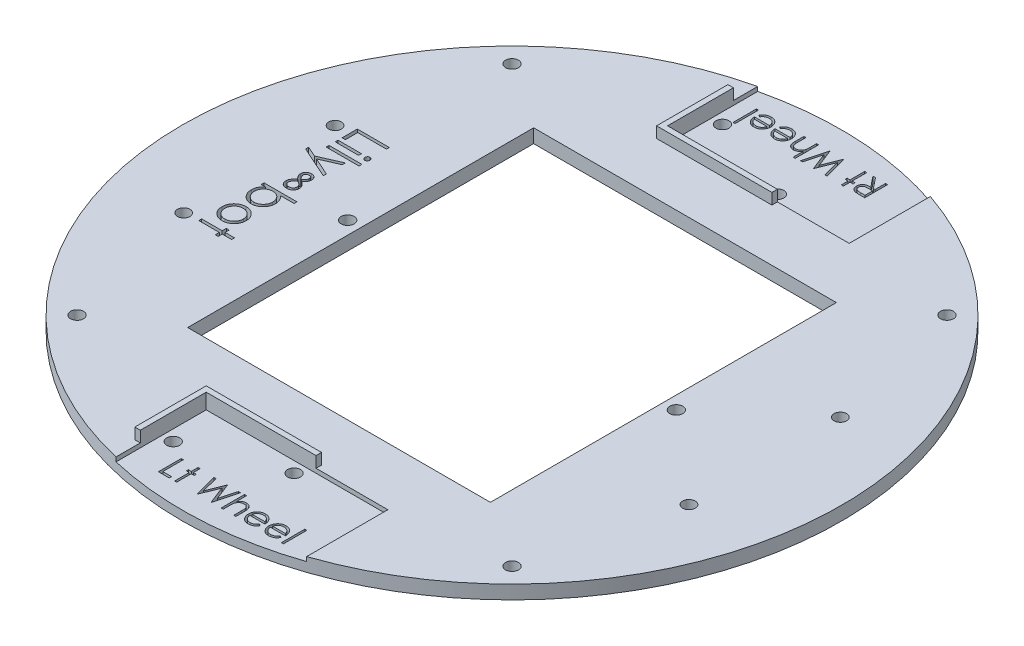
from build123d import *

# Parameters (mm, degrees)
SKETCH1_R                 = 76.2
BASE_DEPTH                = 3.175
SKETCH19_R                = 1.5
CUT_EXTRUDE2_DEPTH        = 108.809835474
CIRPATTERN1_COUNT         = 4
SKETCH16_W                = 5.413782051
SKETCH16_H                = 0.664850428
SKETCH16_W_2              = 7.598290598
SKETCH16_H_2              = 0.664850427
SKETCH16_W_3              = 0.474893163
SKETCH16_H_3              = 5.427350428
SKETCH16_W_4              = 0.474893162
SKETCH16_H_4              = 5.427350427
CUT_EXTRUDE4_DEPTH        = 2.5
CUT_EXTRUDE10_DEPTH       = 1.27
SKETCH27_R                = 1.45
CUT_EXTRUDE8_DEPTH        = 108.809835619
MIRROR3_COPY_1_SKETCH_R   = 1.45
MIRROR3_COPY_1_DEPTH      = 108.809835619
MIRROR3_COPY_2_SKETCH_R   = 1.45
MIRROR3_COPY_2_DEPTH      = 108.809835619
CUT_EXTRUDE11_REACH       = 109.81
SKETCH29_R                = 1.5
BOSS_EXTRUDE2_DEPTH       = 2.54
SKETCH56_W                = 42
SKETCH56_H                = 22.86
CUT_EXTRUDE12_DEPTH       = 1
SKETCH45_W                = 70
SKETCH45_H                = 80
BATTERY_HOLE_DEPTH        = 108.809835619
F_9V_BATTERY_SCREWS_REACH = 109.81
SKETCH55_R                = 1.5


with BuildPart() as part:
    # Sketch1 → Base (new body)
    with BuildSketch(Plane(origin=(0, 0, 0), x_dir=(1, 0, 0), z_dir=(0, 1, 0))):
        Circle(SKETCH1_R)
    extrude(amount=BASE_DEPTH)

    # Sketch19 → Cut-Extrude2 (cut, through all)
    with BuildSketch(Plane(origin=(0, 3.175, 0), x_dir=(1, 0, 0), z_dir=(0, 1, 0))):
        with Locations((-50.289434278, -50.289434278)):
            Circle(SKETCH19_R)
    cut_extrude2 = extrude(amount=-CUT_EXTRUDE2_DEPTH, mode=Mode.SUBTRACT)

    # CirPattern1: Cut-Extrude2 ×4 about axis
    cirpattern1_axis = Axis((0, 3.175, 0), (0, 1, 0))
    for i in range(1, CIRPATTERN1_COUNT):
        add(cut_extrude2.rotate(cirpattern1_axis, i * 360 / CIRPATTERN1_COUNT), mode=Mode.SUBTRACT)

    # Sketch16 → Cut-Extrude4 (cut)
    # profile 1 of 23: a face of its own
    with BuildSketch(Plane(origin=(0, 3.175, 0), x_dir=(1, 0, 0), z_dir=(0, 1, 0))):
        Polygon((-47.730770348, 19.370213675), (-47.730770348, 18.705363248), (-54.379274621, 18.705363248), (-54.379274621, 15.856004274), (-55.139103681, 15.856004274), (-55.139103681, 19.370213675), align=None)
    # profile 2 of 23: a face of its own
    with BuildSketch(Plane(origin=(0, 3.175, 0), x_dir=(1, 0, 0), z_dir=(0, 1, 0))):
        with BuildLine():
            add(Edge.make_bspline(
                [(-47.44583445, 14.576760817), (-47.447756541, 14.535511087), (-47.451520364, 14.454736194), (-47.483494243, 14.337812599), (-47.538518629, 14.231452647), (-47.609941625, 14.135706096), (-47.697391959, 14.056336606), (-47.796754869, 13.999424457), (-47.904926866, 13.963091915), (-47.980298808, 13.958678638), (-48.018674327, 13.956431624)],
                knots=[0, 0, 0, 0, 1.054986045, 2.065865298, 3.074122704, 4.105114675, 5.109626121, 6.074217918, 7.019490725, 8, 8, 8, 8], degree=3))
            add(Edge.make_bspline(
                [(-48.018674327, 13.956431624), (-48.056053738, 13.958728905), (-48.129948409, 13.963270359), (-48.23624484, 13.999397599), (-48.334224143, 14.056813747), (-48.421503506, 14.135653268), (-48.49288524, 14.231466599), (-48.547920528, 14.337808908), (-48.579891527, 14.454737165), (-48.583655747, 14.535511416), (-48.58557804, 14.576760817)],
                knots=[0, 0, 0, 0, 0.961106377, 1.899993565, 2.859409042, 3.870007927, 4.90724781, 5.921615355, 6.938620636, 8, 8, 8, 8], degree=3))
            add(Edge.make_bspline(
                [(-48.58557804, 14.576760817), (-48.583717484, 14.61753646), (-48.580096154, 14.696900922), (-48.547538023, 14.811674635), (-48.493004919, 14.916323218), (-48.420515678, 15.010503955), (-48.334804494, 15.090906582), (-48.23617083, 15.14811088), (-48.129967252, 15.184334713), (-48.056060068, 15.18886315), (-48.018674327, 15.191153846)],
                knots=[0, 0, 0, 0, 1.055304112, 2.054011575, 3.063363921, 4.096942562, 5.122536081, 6.088009498, 7.032825006, 8, 8, 8, 8], degree=3))
            add(Edge.make_bspline(
                [(-48.018674327, 15.191153846), (-47.980292238, 15.188913662), (-47.904907391, 15.184513798), (-47.796830145, 15.148082765), (-47.696806658, 15.091389609), (-47.610928736, 15.010452004), (-47.538399214, 14.916336818), (-47.483876643, 14.811671093), (-47.451315758, 14.696901862), (-47.44769481, 14.617536779), (-47.44583445, 14.576760817)],
                knots=[0, 0, 0, 0, 0.986662878, 1.937868148, 2.908513651, 3.927890639, 4.955204348, 5.958438607, 6.951092507, 8, 8, 8, 8], degree=3))
        make_face()
    # profile 3 of 23: a face of its own
    with BuildSketch(Plane(origin=(0, 3.175, 0), x_dir=(1, 0, 0), z_dir=(0, 1, 0))):
        with Locations((-52.432212656, 14.573792735)):
            Rectangle(SKETCH16_W, SKETCH16_H)
    # profile 4 of 23: a face of its own
    with BuildSketch(Plane(origin=(0, 3.175, 0), x_dir=(1, 0, 0), z_dir=(0, 1, 0))):
        with Locations((-51.339958382, 12.48426282)):
            Rectangle(SKETCH16_W_2, SKETCH16_H_2)
    # profile 5 of 23: a face of its own
    with BuildSketch(Plane(origin=(0, 3.175, 0), x_dir=(1, 0, 0), z_dir=(0, 1, 0))):
        Polygon((-49.72532163, 11.202051282), (-49.72532163, 10.485259415), (-53.871732554, 8.652468616), (-49.72532163, 6.791481036), (-49.72532163, 6.073205128), (-57.133654963, 9.397457265), (-57.133654963, 10.115733173), (-54.677566889, 9.013090612), align=None)
    # profile 6 of 23: a face of its own
    with BuildSketch(Plane(origin=(0, 3.175, 0), x_dir=(1, 0, 0), z_dir=(0, 1, 0))):
        with BuildLine():
            add(Edge.make_bspline(
                [(-51.001597004, 2.416527778), (-50.946879284, 2.369875633), (-50.841260178, 2.279825136), (-50.693915669, 2.144522154), (-50.559061448, 2.018665822), (-50.441100246, 1.899018702), (-50.337959563, 1.787316814), (-50.24945227, 1.683485131), (-50.177061256, 1.585973556), (-50.099794758, 1.46783701), (-50.024296602, 1.321698793), (-49.962433943, 1.139990803), (-49.921140742, 0.953141623), (-49.9172408, 0.82585483), (-49.915278895, 0.761821915)],
                knots=[0, 0, 0, 0, 1.262120639, 2.4362136, 3.51119946, 4.499802099, 5.384768269, 6.179737702, 6.893542511, 7.514954886, 8.656748073, 9.768967886, 10.877656618, 12, 12, 12, 12], degree=3))
            add(Edge.make_bspline(
                [(-49.915278895, 0.761821915), (-49.916350226, 0.716734324), (-49.918477804, 0.627193979), (-49.937673761, 0.494840031), (-49.964374873, 0.365065109), (-50.007857192, 0.239736478), (-50.058782347, 0.116455196), (-50.123061578, -0.002774837), (-50.2001255, -0.117669182), (-50.286138776, -0.229776239), (-50.384630954, -0.334722323), (-50.499725758, -0.423778383), (-50.625235639, -0.501997405), (-50.765980981, -0.562016187), (-50.91760908, -0.611948556), (-51.083561412, -0.644890488), (-51.261745332, -0.666050662), (-51.384909348, -0.668841517), (-51.448293385, -0.670277778)],
                knots=[0, 0, 0, 0, 0.91520134, 1.817516571, 2.712248007, 3.601887663, 4.506939813, 5.419489991, 6.347452901, 7.314151823, 8.28771866, 9.260611264, 10.261783639, 11.282972957, 12.360114573, 13.49907246, 14.71294484, 16, 16, 16, 16], degree=3))
            add(Edge.make_bspline(
                [(-51.448293385, -0.670277778), (-51.513163907, -0.669502863), (-51.638816349, -0.668001874), (-51.82083034, -0.646067978), (-51.990520232, -0.613727304), (-52.148899896, -0.570474478), (-52.293206336, -0.510318666), (-52.425531404, -0.438916172), (-52.545242579, -0.353755702), (-52.651553089, -0.255779831), (-52.745366359, -0.148247002), (-52.826330975, -0.034585541), (-52.896065973, 0.084326144), (-52.952237263, 0.208679481), (-52.995800879, 0.339531183), (-53.026084775, 0.475319602), (-53.046851233, 0.616741836), (-53.048653292, 0.712771101), (-53.049573767, 0.761821915)],
                knots=[0, 0, 0, 0, 1.282436112, 2.484043947, 3.620119009, 4.698072107, 5.724754269, 6.705602683, 7.666779382, 8.622511691, 9.558658178, 10.484572125, 11.379086413, 12.281221437, 13.178567741, 14.10194472, 15.030491823, 16, 16, 16, 16], degree=3))
            add(Edge.make_bspline(
                [(-53.049573767, 0.761821915), (-53.046707243, 0.832289085), (-53.041060221, 0.971108697), (-52.996733612, 1.173290908), (-52.924626706, 1.364151003), (-52.840861421, 1.514892934), (-52.755451704, 1.632146917), (-52.67965104, 1.727620146), (-52.590193097, 1.827905974), (-52.489171515, 1.934732849), (-52.376115471, 2.047849497), (-52.250293935, 2.166000093), (-52.111260777, 2.289648469), (-52.013850487, 2.373154704), (-51.963255658, 2.416527778)],
                knots=[0, 0, 0, 0, 1.235527725, 2.433977122, 3.612364057, 4.805237555, 5.445928094, 6.156208864, 6.943311665, 7.802879459, 8.735743811, 9.74885745, 10.830758309, 12, 12, 12, 12], degree=3))
            add(Edge.make_bspline(
                [(-51.963255658, 2.416527778), (-52.027203479, 2.473252315), (-52.150913099, 2.582988205), (-52.312500338, 2.761425629), (-52.452432036, 2.939269556), (-52.566112325, 3.121243803), (-52.655069514, 3.306258151), (-52.717168328, 3.494870249), (-52.7584944, 3.685565912), (-52.762597236, 3.814286397), (-52.764637869, 3.878308293)],
                knots=[0, 0, 0, 0, 1.191292225, 2.304602505, 3.351984481, 4.343602045, 5.290962719, 6.207243005, 7.108333825, 8, 8, 8, 8], degree=3))
            add(Edge.make_bspline(
                [(-52.764637869, 3.878308293), (-52.763553796, 3.920430826), (-52.761401334, 4.004066492), (-52.742544217, 4.126614803), (-52.715695985, 4.245164157), (-52.672186118, 4.357121501), (-52.621334361, 4.46583984), (-52.556368488, 4.568882735), (-52.480368629, 4.667318626), (-52.39317454, 4.759436385), (-52.299380332, 4.845530691), (-52.197953106, 4.920334173), (-52.090388899, 4.982148291), (-51.979389967, 5.035449321), (-51.861614767, 5.072913316), (-51.740548584, 5.103929686), (-51.612935064, 5.119629401), (-51.526486616, 5.122139486), (-51.482426331, 5.123418803)],
                knots=[0, 0, 0, 0, 1.015621977, 2.016550638, 2.986324728, 3.941818701, 4.908060977, 5.878422452, 6.873928306, 7.904103179, 8.934969212, 9.94235257, 10.937214292, 11.925034945, 12.906344809, 13.913728167, 14.936687286, 16, 16, 16, 16], degree=3))
            add(Edge.make_bspline(
                [(-51.482426331, 5.123418803), (-51.438366045, 5.122139486), (-51.351917597, 5.119629401), (-51.224304077, 5.103929686), (-51.103237894, 5.072913316), (-50.985462694, 5.035449321), (-50.874463762, 4.982148291), (-50.766899555, 4.920334173), (-50.665472329, 4.845530691), (-50.571678121, 4.759436385), (-50.484484032, 4.667318626), (-50.408484174, 4.568882735), (-50.3435183, 4.46583984), (-50.292666543, 4.357121501), (-50.249156676, 4.245164157), (-50.222308445, 4.126614803), (-50.203451327, 4.004066492), (-50.201298865, 3.920430826), (-50.200214792, 3.878308293)],
                knots=[0, 0, 0, 0, 1.063312714, 2.086271833, 3.093655191, 4.074965055, 5.062785708, 6.05764743, 7.065030788, 8.095896821, 9.126071694, 10.121577548, 11.091939023, 12.058181299, 13.013675272, 13.983449362, 14.984378023, 16, 16, 16, 16], degree=3))
            add(Edge.make_bspline(
                [(-50.200214792, 3.878308293), (-50.202255426, 3.814286397), (-50.206358261, 3.685565912), (-50.247684333, 3.494870249), (-50.309783147, 3.306258151), (-50.398740336, 3.121243803), (-50.512420626, 2.939269556), (-50.652352323, 2.761425629), (-50.813939562, 2.582988205), (-50.937649182, 2.473252315), (-51.001597004, 2.416527778)],
                knots=[0, 0, 0, 0, 0.891666175, 1.792756995, 2.709037281, 3.656397955, 4.648015519, 5.695397495, 6.808707775, 8, 8, 8, 8], degree=3))
        make_face()
        with BuildLine():
            add(Edge.make_bspline(
                [(-51.477974207, 2.084102564), (-51.525141418, 2.050202907), (-51.616739776, 1.984370033), (-51.747216981, 1.88471038), (-51.867975201, 1.788910015), (-51.976658826, 1.693528139), (-52.074263575, 1.600035276), (-52.162626487, 1.510036413), (-52.23843782, 1.42082835), (-52.283120329, 1.360617889), (-52.304585118, 1.33169371)],
                knots=[0, 0, 0, 0, 1.241475023, 2.410934931, 3.50905305, 4.53555441, 5.500295932, 6.397611924, 7.230237439, 8, 8, 8, 8], degree=3))
            add(Edge.make_bspline(
                [(-52.304585118, 1.33169371), (-52.331889474, 1.289981816), (-52.38527734, 1.208423071), (-52.438068719, 1.072030045), (-52.474645333, 0.931463517), (-52.478013532, 0.834282373), (-52.479701972, 0.785566573)],
                knots=[0, 0, 0, 0, 1.024195813, 2.002597298, 2.998724793, 4, 4, 4, 4], degree=3))
            add(Edge.make_bspline(
                [(-52.479701972, 0.785566573), (-52.476817262, 0.72435174), (-52.471205065, 0.60525838), (-52.419850625, 0.434934586), (-52.337350441, 0.28081445), (-52.221470846, 0.146193498), (-52.076550148, 0.035110357), (-51.903097964, -0.043863235), (-51.705126396, -0.091974579), (-51.564833921, -0.097507253), (-51.491330577, -0.100405983)],
                knots=[0, 0, 0, 0, 0.982463644, 1.911381441, 2.833323024, 3.775635463, 4.746270549, 5.746452047, 6.819300104, 8, 8, 8, 8], degree=3))
            add(Edge.make_bspline(
                [(-51.491330577, -0.100405983), (-51.414877328, -0.097511534), (-51.26972131, -0.092016063), (-51.065437225, -0.044554127), (-50.888367889, 0.035839313), (-50.742708403, 0.150936265), (-50.627856225, 0.289725468), (-50.544566645, 0.447260247), (-50.49373148, 0.621702238), (-50.488063446, 0.743666641), (-50.48515069, 0.806343149)],
                knots=[0, 0, 0, 0, 1.200537896, 2.279370744, 3.274320026, 4.23252291, 5.171379044, 6.086195165, 7.016511361, 8, 8, 8, 8], degree=3))
            add(Edge.make_bspline(
                [(-50.48515069, 0.806343149), (-50.487214308, 0.85003761), (-50.491370078, 0.938030701), (-50.52354531, 1.068708356), (-50.579187085, 1.196125287), (-50.640417148, 1.302595317), (-50.707548654, 1.389452762), (-50.771183631, 1.465855862), (-50.85248645, 1.548621429), (-50.948459077, 1.639677974), (-51.059075343, 1.739898607), (-51.184867214, 1.847649364), (-51.326333627, 1.963356965), (-51.425937845, 2.042667997), (-51.477974207, 2.084102564)],
                knots=[0, 0, 0, 0, 0.938556634, 1.890090837, 2.871507503, 3.919970121, 4.519609271, 5.228840992, 6.0559402, 7.010972376, 8.072293473, 9.263533308, 10.570384103, 12, 12, 12, 12], degree=3))
        make_face(mode=Mode.SUBTRACT)
        with BuildLine():
            add(Edge.make_bspline(
                [(-51.482426331, 2.748952991), (-51.414383521, 2.810481964), (-51.288199766, 2.924585964), (-51.124729788, 3.093705504), (-50.99731293, 3.24283298), (-50.906961415, 3.379316868), (-50.846624494, 3.506733215), (-50.801817053, 3.628015361), (-50.775991194, 3.748603853), (-50.772025928, 3.828731165), (-50.770086587, 3.867920005)],
                knots=[0, 0, 0, 0, 1.609393741, 2.984582011, 4.124943536, 5.047112895, 5.84692537, 6.593777195, 7.312241493, 8, 8, 8, 8], degree=3))
            add(Edge.make_bspline(
                [(-50.770086587, 3.867920005), (-50.772158069, 3.916144052), (-50.776150354, 4.009084355), (-50.813023903, 4.142180425), (-50.874650786, 4.260608517), (-50.958790527, 4.364309479), (-51.062952349, 4.449449552), (-51.186241974, 4.511762747), (-51.327108134, 4.547389135), (-51.426322024, 4.551438731), (-51.477974207, 4.553547009)],
                knots=[0, 0, 0, 0, 1.042542922, 2.009251829, 2.962635248, 3.91451315, 4.881459403, 5.853907612, 6.882713315, 8, 8, 8, 8], degree=3))
            add(Edge.make_bspline(
                [(-51.477974207, 4.553547009), (-51.529220852, 4.551739248), (-51.62836872, 4.548241739), (-51.768385009, 4.507865553), (-51.89428526, 4.445026058), (-51.999547627, 4.355195638), (-52.0870577, 4.249546578), (-52.149852173, 4.129252296), (-52.188881115, 3.996950961), (-52.192770827, 3.904800666), (-52.194766074, 3.857531717)],
                knots=[0, 0, 0, 0, 1.096681994, 2.121771714, 3.099774617, 4.094684217, 5.067893667, 6.027049023, 6.987965052, 8, 8, 8, 8], degree=3))
            add(Edge.make_bspline(
                [(-52.194766074, 3.857531717), (-52.192121245, 3.81432459), (-52.186701058, 3.725777972), (-52.152648184, 3.59178176), (-52.094372902, 3.456667866), (-52.017229761, 3.317340589), (-51.914147663, 3.178536129), (-51.791955532, 3.034985262), (-51.646364467, 2.890338813), (-51.538432354, 2.79725449), (-51.482426331, 2.748952991)],
                knots=[0, 0, 0, 0, 0.764233998, 1.566184533, 2.428812488, 3.360851394, 4.375699984, 5.480091042, 6.692418094, 8, 8, 8, 8], degree=3))
        make_face(mode=Mode.SUBTRACT)
    # profile 7 of 23: a face of its own
    with BuildSketch(Plane(origin=(0, 3.175, 0), x_dir=(1, 0, 0), z_dir=(0, 1, 0))):
        with BuildLine():
            Line((-55.139103681, -2.189935897), (-47.540813083, -2.189935897))
            Line((-47.540813083, -2.189935897), (-47.540813083, -2.854786325))
            Line((-47.540813083, -2.854786325), (-50.707756859, -2.854786325))
            add(Edge.make_bspline(
                [(-50.707756859, -2.854786325), (-50.621309061, -2.929042849), (-50.45212698, -3.07436608), (-50.234489335, -3.320847188), (-50.045900925, -3.576704127), (-49.89427815, -3.848237231), (-49.775594059, -4.133064839), (-49.691302971, -4.430883085), (-49.638900738, -4.742613529), (-49.633228703, -4.954990569), (-49.630342997, -5.06303953)],
                knots=[0, 0, 0, 0, 1.073845349, 2.101561798, 3.093746447, 4.06731023, 5.027507813, 5.99794647, 6.981435071, 8, 8, 8, 8], degree=3))
            add(Edge.make_bspline(
                [(-49.630342997, -5.06303953), (-49.632962222, -5.158643426), (-49.638140875, -5.347668622), (-49.677669503, -5.625516831), (-49.741207404, -5.892543993), (-49.830960552, -6.148808011), (-49.947412091, -6.394170581), (-50.08879746, -6.629489377), (-50.256431886, -6.853637866), (-50.448228839, -7.063278067), (-50.656384879, -7.25657669), (-50.879110986, -7.425518954), (-51.112429802, -7.569027287), (-51.357875828, -7.684471657), (-51.612433021, -7.778669726), (-51.879746157, -7.840899075), (-52.157432676, -7.881097378), (-52.34648905, -7.886107046), (-52.442600943, -7.888653846)],
                knots=[0, 0, 0, 0, 1.034424137, 2.045232812, 3.030843571, 4.001080581, 4.978206309, 5.965255608, 6.967506581, 8.002193933, 9.036548792, 10.037741014, 11.022988172, 11.995276286, 12.96911093, 13.954721688, 14.960227752, 16, 16, 16, 16], degree=3))
            add(Edge.make_bspline(
                [(-52.442600943, -7.888653846), (-52.537215981, -7.886036714), (-52.723781934, -7.880876141), (-52.998327478, -7.841461038), (-53.262569391, -7.776381445), (-53.515824869, -7.683330274), (-53.759283686, -7.56635282), (-53.990170541, -7.420067287), (-54.21250304, -7.251134004), (-54.419139726, -7.05569974), (-54.610133757, -6.844216053), (-54.776092838, -6.617914239), (-54.919427408, -6.382494505), (-55.032998106, -6.134287584), (-55.124863389, -5.876968563), (-55.188612502, -5.607780661), (-55.225808801, -5.328246828), (-55.231302752, -5.138341848), (-55.234082314, -5.042262954)],
                knots=[0, 0, 0, 0, 1.024244038, 2.01964794, 2.996620209, 3.965911562, 4.936179293, 5.91563013, 6.920572822, 7.955171681, 8.990768464, 10.002129126, 10.989675881, 11.969873457, 12.952483066, 13.943799762, 14.959703725, 16, 16, 16, 16], degree=3))
            add(Edge.make_bspline(
                [(-55.234082314, -5.042262954), (-55.231037693, -4.932268413), (-55.225067724, -4.716588296), (-55.175431574, -4.401117805), (-55.091423262, -4.102848264), (-54.977406016, -3.818425993), (-54.823803513, -3.551039138), (-54.634333914, -3.298054239), (-54.403308376, -3.06368986), (-54.227538746, -2.925613835), (-54.137375917, -2.854786325)],
                knots=[0, 0, 0, 0, 1.035884751, 2.031189381, 2.999123778, 3.950239786, 4.910390163, 5.895605504, 6.920529319, 8, 8, 8, 8], degree=3))
            Line((-54.137375917, -2.854786325), (-55.139103681, -2.854786325))
            Line((-55.139103681, -2.854786325), (-55.139103681, -2.189935897))
        make_face()
        with BuildLine():
            add(Edge.make_bspline(
                [(-54.569231886, -5.03632679), (-54.565774001, -5.13351211), (-54.558948685, -5.325340476), (-54.505665058, -5.606950679), (-54.417008315, -5.87642924), (-54.295765454, -6.132437403), (-54.143290428, -6.370897551), (-53.95893602, -6.584109824), (-53.747722199, -6.773076732), (-53.511586833, -6.933428763), (-53.257355397, -7.062882046), (-52.991945287, -7.154068462), (-52.719875857, -7.214694624), (-52.535428612, -7.220753925), (-52.442600943, -7.223803419)],
                knots=[0, 0, 0, 0, 1.031861621, 2.036730714, 3.032102247, 4.038124785, 5.038035477, 6.029195352, 7.02284546, 8.040167683, 9.05302878, 10.043491941, 11.015338596, 12, 12, 12, 12], degree=3))
            add(Edge.make_bspline(
                [(-52.442600943, -7.223803419), (-52.349845596, -7.219844369), (-52.164705204, -7.211942074), (-51.89063028, -7.155599345), (-51.624224883, -7.060336207), (-51.367551491, -6.930735437), (-51.129244901, -6.768410023), (-50.913913135, -6.580255599), (-50.728658016, -6.364493046), (-50.57414068, -6.125713964), (-50.44807875, -5.871324419), (-50.361621923, -5.603588052), (-50.305026491, -5.328086133), (-50.298487783, -5.140982415), (-50.295193425, -5.046715077)],
                knots=[0, 0, 0, 0, 0.984698701, 1.96546623, 2.957354799, 3.98164001, 5.010280354, 6.011473015, 7.009725998, 8.019440419, 9.024964737, 10.015029379, 10.999924227, 12, 12, 12, 12], degree=3))
            add(Edge.make_bspline(
                [(-50.295193425, -5.046715077), (-50.298486024, -4.950475664), (-50.305021166, -4.759459957), (-50.361720143, -4.477585092), (-50.448611641, -4.202292669), (-50.573321464, -3.939186115), (-50.726060961, -3.694076576), (-50.904845232, -3.474611931), (-51.1107474, -3.28720271), (-51.339753045, -3.13119582), (-51.58823766, -3.008223989), (-51.852191393, -2.917388541), (-52.132347556, -2.86506921), (-52.32415799, -2.85825566), (-52.421824367, -2.854786325)],
                knots=[0, 0, 0, 0, 1.0169775, 2.018493981, 3.029491472, 4.064042901, 5.08895728, 6.077764832, 7.048099865, 8.023317454, 8.999054219, 9.971953187, 10.967355531, 12, 12, 12, 12], degree=3))
            add(Edge.make_bspline(
                [(-52.421824367, -2.854786325), (-52.496622779, -2.856817595), (-52.643849722, -2.860815778), (-52.860019588, -2.891360517), (-53.066889477, -2.939948321), (-53.264675889, -3.008414832), (-53.452288952, -3.098353039), (-53.631061981, -3.206833801), (-53.800117423, -3.3357262), (-53.956927295, -3.48310248), (-54.100344115, -3.643754682), (-54.226264703, -3.815340708), (-54.33150948, -3.996759396), (-54.418266564, -4.187167399), (-54.487425938, -4.386135361), (-54.533534777, -4.595417722), (-54.565203094, -4.812753215), (-54.567874816, -4.961017599), (-54.569231886, -5.03632679)],
                knots=[0, 0, 0, 0, 1.050410851, 2.067540964, 3.060285716, 4.031641603, 5.001405429, 5.977447716, 6.964216063, 7.981915705, 8.995836261, 9.985438752, 10.966317358, 11.93650433, 12.920994585, 13.918930257, 14.942944538, 16, 16, 16, 16], degree=3))
        make_face(mode=Mode.SUBTRACT)
    # profile 8 of 23: a face of its own
    with BuildSketch(Plane(origin=(0, 3.175, 0), x_dir=(1, 0, 0), z_dir=(0, 1, 0))):
        with BuildLine():
            add(Edge.make_bspline(
                [(-49.630342997, -11.833235176), (-49.632499653, -11.934819225), (-49.636728326, -12.13400072), (-49.682146557, -12.42565837), (-49.751020403, -12.703775093), (-49.847969302, -12.969543926), (-49.975170043, -13.220766423), (-50.128993591, -13.459685589), (-50.310480647, -13.685822739), (-50.450950385, -13.821332499), (-50.522251718, -13.890116186)],
                knots=[0, 0, 0, 0, 1.054042676, 2.066720093, 3.05716247, 4.025731183, 4.997454851, 5.974904663, 6.97207755, 8, 8, 8, 8], degree=3))
            add(Edge.make_bspline(
                [(-50.522251718, -13.890116186), (-50.590437988, -13.949344655), (-50.725490936, -14.06665536), (-50.944471983, -14.217077798), (-51.171251863, -14.346663434), (-51.408842037, -14.450513368), (-51.655168425, -14.532396668), (-51.911077682, -14.590532392), (-52.17600465, -14.625112238), (-52.35592944, -14.629775184), (-52.447053067, -14.632136752)],
                knots=[0, 0, 0, 0, 1.025258237, 2.030674902, 3.01204498, 3.988269485, 4.97094183, 5.956517959, 6.965070386, 8, 8, 8, 8], degree=3))
            add(Edge.make_bspline(
                [(-52.447053067, -14.632136752), (-52.538704856, -14.630059588), (-52.719813065, -14.625955015), (-52.986554054, -14.587127693), (-53.245199769, -14.526736898), (-53.494667309, -14.440309494), (-53.735719401, -14.329484878), (-53.967302539, -14.194249405), (-54.189876122, -14.033655192), (-54.401540606, -13.851610649), (-54.596648413, -13.650427768), (-54.766594551, -13.432128108), (-54.912806514, -13.200843373), (-55.028939467, -12.953416297), (-55.122550716, -12.693368925), (-55.187101696, -12.419047193), (-55.226479546, -12.13069582), (-55.23151241, -11.933783471), (-55.234082314, -11.833235176)],
                knots=[0, 0, 0, 0, 0.998669827, 1.973418153, 2.932281609, 3.89081133, 4.846438734, 5.82045571, 6.809776312, 7.834649874, 8.860672198, 9.859676908, 10.845817165, 11.837296335, 12.833502054, 13.853824644, 14.904110009, 16, 16, 16, 16], degree=3))
            add(Edge.make_bspline(
                [(-55.234082314, -11.833235176), (-55.231491146, -11.73219909), (-55.226416214, -11.534314811), (-55.187394612, -11.244877674), (-55.121861016, -10.969400962), (-55.030098354, -10.708123506), (-54.911852635, -10.460697432), (-54.767163448, -10.228558675), (-54.596562356, -10.010156048), (-54.401563924, -9.808910093), (-54.189870114, -9.626882461), (-53.967304099, -9.466283884), (-53.735718994, -9.331049544), (-53.494667418, -9.220224631), (-53.24519974, -9.133797307), (-52.986554062, -9.07340649), (-52.719813063, -9.034579174), (-52.538704855, -9.0304746), (-52.447053067, -9.028397436)],
                knots=[0, 0, 0, 0, 1.099861214, 2.154133753, 3.1731438, 4.178222029, 5.163564916, 6.153006591, 7.15072618, 8.175428628, 9.198983792, 10.187031731, 11.15979573, 12.114193814, 13.071490482, 14.029120454, 15.002614863, 16, 16, 16, 16], degree=3))
            add(Edge.make_bspline(
                [(-52.447053067, -9.028397436), (-52.356424711, -9.030775109), (-52.176996143, -9.035482495), (-51.912567198, -9.070027572), (-51.657091058, -9.127936517), (-51.411715467, -9.209917972), (-51.17516646, -9.314725127), (-50.947826235, -9.442489853), (-50.729835391, -9.594446692), (-50.594956988, -9.711290822), (-50.526703841, -9.770418002)],
                knots=[0, 0, 0, 0, 1.031353054, 2.041901799, 3.029428768, 4.008703097, 4.981709435, 5.96992636, 6.972712378, 8, 8, 8, 8], degree=3))
            add(Edge.make_bspline(
                [(-50.526703841, -9.770418002), (-50.454796176, -9.839103683), (-50.313377099, -9.974186159), (-50.132248126, -10.20136719), (-49.976350667, -10.439258608), (-49.849213941, -10.692101577), (-49.751196309, -10.958609399), (-49.681825102, -11.238793141), (-49.636929224, -11.531512367), (-49.632560285, -11.731658595), (-49.630342997, -11.833235176)],
                knots=[0, 0, 0, 0, 1.027951202, 2.021646915, 2.998468564, 3.9668038, 4.943370589, 5.93035926, 6.949632805, 8, 8, 8, 8], degree=3))
        make_face()
        with BuildLine():
            add(Edge.make_bspline(
                [(-50.295193425, -11.830267094), (-50.297235254, -11.758432564), (-50.301266203, -11.616617901), (-50.331922209, -11.407871949), (-50.380500316, -11.206919595), (-50.449490519, -11.013353939), (-50.538681833, -10.827923628), (-50.647613431, -10.650424637), (-50.776865493, -10.48133384), (-50.923869013, -10.32195022), (-51.083540615, -10.173958393), (-51.255236368, -10.046081805), (-51.434030654, -9.937145196), (-51.62085155, -9.846489694), (-51.817468338, -9.778946663), (-52.021687163, -9.729898768), (-52.233915226, -9.699269641), (-52.378189436, -9.695276869), (-52.45150519, -9.693247863)],
                knots=[0, 0, 0, 0, 1.021589593, 2.016807015, 2.994807536, 3.958602519, 4.934347097, 5.916793557, 6.916107818, 7.957073844, 8.998039869, 10.008589932, 10.997041759, 11.972786337, 12.956492182, 13.948170289, 14.957322718, 16, 16, 16, 16], degree=3))
            add(Edge.make_bspline(
                [(-52.45150519, -9.693247863), (-52.5462345, -9.696639998), (-52.734254467, -9.703372753), (-53.011076456, -9.758400976), (-53.277332955, -9.84980542), (-53.529818167, -9.975846025), (-53.763831603, -10.131068822), (-53.974257589, -10.312570049), (-54.152981254, -10.522859023), (-54.303290865, -10.754775), (-54.421659542, -11.005031437), (-54.506545624, -11.269432677), (-54.560983793, -11.545571268), (-54.56645846, -11.734537946), (-54.569231886, -11.830267094)],
                knots=[0, 0, 0, 0, 1.016977094, 2.018509362, 3.018404954, 4.033172147, 5.041280572, 6.028085189, 7.007940189, 7.995502847, 8.989109012, 9.972200833, 10.97273166, 12, 12, 12, 12], degree=3))
            add(Edge.make_bspline(
                [(-54.569231886, -11.830267094), (-54.566474525, -11.926001748), (-54.561031571, -12.114979296), (-54.506269822, -12.391502098), (-54.422028657, -12.656627978), (-54.303157174, -12.907144617), (-54.153549384, -13.139166209), (-53.973239417, -13.347953575), (-53.764384775, -13.531017866), (-53.530128453, -13.686394362), (-53.276940436, -13.810404104), (-53.011125516, -13.902238397), (-52.734241973, -13.957134647), (-52.546230314, -13.963885215), (-52.45150519, -13.967286325)],
                knots=[0, 0, 0, 0, 1.027082318, 2.027431966, 3.015401697, 4.008827937, 4.996211763, 5.971861488, 6.96198607, 7.969911943, 8.982141629, 9.981856156, 10.983207064, 12, 12, 12, 12], degree=3))
            add(Edge.make_bspline(
                [(-52.45150519, -13.967286325), (-52.378183582, -13.965272416), (-52.233897852, -13.961309352), (-52.021753579, -13.930464141), (-51.817064421, -13.882178157), (-51.621643904, -13.811677399), (-51.433118211, -13.724133247), (-51.255773258, -13.612546629), (-51.083431467, -13.485265664), (-50.923965253, -13.337002276), (-50.776328376, -13.177636599), (-50.648084268, -13.007275499), (-50.538619627, -12.829694072), (-50.449479535, -12.644205161), (-50.380765861, -12.451077535), (-50.331710595, -12.250735282), (-50.301377978, -12.042913757), (-50.297268128, -11.901602666), (-50.295193425, -11.830267094)],
                knots=[0, 0, 0, 0, 1.043020522, 2.052505155, 3.044509714, 4.030878336, 5.003918577, 5.996372628, 7.007255355, 8.048564058, 9.08987276, 10.095126797, 11.077896669, 12.053962454, 13.01807471, 13.98956039, 14.985105429, 16, 16, 16, 16], degree=3))
        make_face(mode=Mode.SUBTRACT)
    # profile 9 of 23: a face of its own
    with BuildSketch(Plane(origin=(0, 3.175, 0), x_dir=(1, 0, 0), z_dir=(0, 1, 0))):
        Polygon((-47.540813083, -16.626688034), (-47.540813083, -17.291538462), (-49.72532163, -17.291538462), (-49.72532163, -18.241324786), (-50.390172057, -18.241324786), (-50.390172057, -17.291538462), (-55.139103681, -17.291538462), (-55.139103681, -16.626688034), (-50.390172057, -16.626688034), (-50.390172057, -15.676901709), (-49.72532163, -15.676901709), (-49.72532163, -16.626688034), align=None)
    # profile 10 of 23: a face of its own
    with BuildSketch(Plane(origin=(0, 3.175, 0), x_dir=(1, 0, 0), z_dir=(0, 1, 0))):
        Polygon((-10.50904499, -65.967725365), (-10.034151828, -65.967725365), (-10.034151828, -70.716656989), (-7.998895417, -70.716656989), (-7.998895417, -71.259392032), (-10.50904499, -71.259392032), align=None)
    # profile 11 of 23: a face of its own
    with BuildSketch(Plane(origin=(0, 3.175, 0), x_dir=(1, 0, 0), z_dir=(0, 1, 0))):
        Polygon((-6.777741571, -65.832041604), (-6.302848409, -65.832041604), (-6.302848409, -67.392404852), (-5.624429605, -67.392404852), (-5.624429605, -67.867298015), (-6.302848409, -67.867298015), (-6.302848409, -71.259392032), (-6.777741571, -71.259392032), (-6.777741571, -67.867298015), (-7.456160375, -67.867298015), (-7.456160375, -67.392404852), (-6.777741571, -67.392404852), align=None)
    # profile 12 of 23: a face of its own
    with BuildSketch(Plane(origin=(0, 3.175, 0), x_dir=(1, 0, 0), z_dir=(0, 1, 0))):
        Polygon((-2.978596272, -65.967725365), (-2.487802669, -65.967725365), (-1.452153964, -69.848492926), (0.088068725, -65.967725365), (0.156970635, -65.967725365), (1.668572531, -69.821992192), (2.709521383, -65.967725365), (3.195014839, -65.967725365), (1.768215293, -71.259392032), (1.700373413, -71.259392032), (0.108209283, -67.212199858), (-1.503035375, -71.259392032), (-1.570877255, -71.259392032), align=None)
    # profile 13 of 23: a face of its own
    with BuildSketch(Plane(origin=(0, 3.175, 0), x_dir=(1, 0, 0), z_dir=(0, 1, 0))):
        with BuildLine():
            Line((4.009117403, -65.832041604), (4.484010565, -65.832041604))
            Line((4.484010565, -65.832041604), (4.484010565, -68.122765095))
            add(Edge.make_bspline(
                [(4.484010565, -68.122765095), (4.534987914, -68.059047408), (4.634243425, -67.934985806), (4.80130303, -67.773119482), (4.972860182, -67.632816804), (5.154840311, -67.521131708), (5.343904788, -67.432902173), (5.540851012, -67.370327993), (5.745715576, -67.331848359), (5.884848839, -67.327012656), (5.955331345, -67.324562972)],
                knots=[0, 0, 0, 0, 1.125788106, 2.19196713, 3.20547328, 4.180437432, 5.132270164, 6.079753143, 7.027236121, 8, 8, 8, 8], degree=3))
            add(Edge.make_bspline(
                [(5.955331345, -67.324562972), (6.026890392, -67.327201896), (6.166948706, -67.332366908), (6.370876632, -67.373208567), (6.561317479, -67.442994218), (6.737705122, -67.538496743), (6.896190081, -67.657442566), (7.036570081, -67.794771177), (7.151234146, -67.953935315), (7.229247097, -68.100977509), (7.280006892, -68.231815863), (7.312137629, -68.344054399), (7.339380941, -68.469122054), (7.363117446, -68.606954447), (7.378937385, -68.758213218), (7.391644367, -68.92221596), (7.400680197, -69.098953269), (7.401030361, -69.22129698), (7.40121142, -69.284557296)],
                knots=[0, 0, 0, 0, 1.235656852, 2.418478516, 3.575258207, 4.727955599, 5.870717718, 6.98870536, 8.107142894, 9.245821548, 9.854588956, 10.528768408, 11.260415777, 12.065282286, 12.943670737, 13.886611085, 14.907229059, 16, 16, 16, 16], degree=3))
            Line((7.40121142, -69.284557296), (7.40121142, -71.259392032))
            Line((7.40121142, -71.259392032), (6.926318258, -71.259392032))
            Line((6.926318258, -71.259392032), (6.926318258, -69.440381615))
            add(Edge.make_bspline(
                [(6.926318258, -69.440381615), (6.926030537, -69.387733055), (6.925480178, -69.28702532), (6.923660835, -69.142840847), (6.919599533, -69.012066929), (6.913036618, -68.895122681), (6.906134308, -68.791845066), (6.896634531, -68.702384067), (6.885582153, -68.626616812), (6.875650782, -68.581010766), (6.87119673, -68.560557229)],
                knots=[0, 0, 0, 0, 1.430932559, 2.737130458, 3.918967929, 4.986496826, 5.920444988, 6.731744033, 7.431208747, 8, 8, 8, 8], degree=3))
            add(Edge.make_bspline(
                [(6.87119673, -68.560557229), (6.853924359, -68.500543283), (6.820718328, -68.385166821), (6.743538648, -68.22843913), (6.647141095, -68.094809819), (6.52944345, -67.986082265), (6.392527828, -67.90079339), (6.235501454, -67.841726624), (6.059842207, -67.805066377), (5.936090577, -67.801378383), (5.871589024, -67.799456134)],
                knots=[0, 0, 0, 0, 1.090059168, 2.095632401, 3.037101401, 3.955032261, 4.878929692, 5.839099886, 6.873700383, 8, 8, 8, 8], degree=3))
            add(Edge.make_bspline(
                [(5.871589024, -67.799456134), (5.833386558, -67.800175538), (5.757784863, -67.80159922), (5.645679142, -67.815892615), (5.536929249, -67.839249606), (5.430487861, -67.870855277), (5.328610883, -67.91386222), (5.228328773, -67.96364953), (5.132482767, -68.024591772), (5.039370877, -68.092968825), (4.952712225, -68.168669534), (4.872086705, -68.248569096), (4.800213263, -68.333651483), (4.735097655, -68.422551658), (4.678887628, -68.516489013), (4.629821658, -68.614557685), (4.588190308, -68.716886643), (4.56750338, -68.787908462), (4.557152593, -68.823444516)],
                knots=[0, 0, 0, 0, 1.024319606, 2.027102035, 3.025350316, 4.005802111, 5.00026367, 5.987881639, 7.005602596, 8.042517216, 9.083927026, 10.089214625, 11.084353441, 12.06828073, 13.041928858, 14.016821737, 15.00770877, 16, 16, 16, 16], degree=3))
            add(Edge.make_bspline(
                [(4.557152593, -68.823444516), (4.551196554, -68.849178572), (4.538217612, -68.905256249), (4.524134471, -68.997746001), (4.511528517, -69.105221825), (4.500871781, -69.227520709), (4.494335686, -69.365090802), (4.48729287, -69.516993323), (4.484671206, -69.684179783), (4.48423736, -69.800438467), (4.484010565, -69.861213279)],
                knots=[0, 0, 0, 0, 0.607992626, 1.324890765, 2.152360218, 3.099583803, 4.150613268, 5.323148443, 6.60066238, 8, 8, 8, 8], degree=3))
            Line((4.484010565, -69.861213279), (4.484010565, -71.259392032))
            Line((4.484010565, -71.259392032), (4.009117403, -71.259392032))
            Line((4.009117403, -71.259392032), (4.009117403, -65.832041604))
        make_face()
    # profile 14 of 23: a face of its own
    with BuildSketch(Plane(origin=(0, 3.175, 0), x_dir=(1, 0, 0), z_dir=(0, 1, 0))):
        with BuildLine():
            Line((11.66040947, -70.038238186), (12.082301164, -70.259784326))
            add(Edge.make_bspline(
                [(12.082301164, -70.259784326), (12.04868155, -70.319418886), (11.983271094, -70.435444125), (11.870784249, -70.594847057), (11.752867663, -70.73824777), (11.624198568, -70.861815224), (11.488626554, -70.969540532), (11.345399802, -71.063789386), (11.193772661, -71.14409953), (11.033737958, -71.21176109), (10.863951732, -71.263784968), (10.684002534, -71.300530635), (10.493545631, -71.323244387), (10.36299843, -71.325882873), (10.296151658, -71.327233912)],
                knots=[0, 0, 0, 0, 1.120438281, 2.179929193, 3.190490725, 4.156257408, 5.095198341, 6.022838206, 6.959905092, 7.901321166, 8.864066838, 9.862729781, 10.905609505, 12, 12, 12, 12], degree=3))
            add(Edge.make_bspline(
                [(10.296151658, -71.327233912), (10.221853668, -71.325499492), (10.076919814, -71.322116142), (9.865949006, -71.292947773), (9.667315838, -71.245364564), (9.481031477, -71.178892852), (9.307552119, -71.092068207), (9.146532969, -70.986296134), (8.997127257, -70.862119987), (8.864043036, -70.718464173), (8.744233833, -70.564730738), (8.638512652, -70.404535532), (8.550130584, -70.238281609), (8.478235566, -70.067027364), (8.420171068, -69.891852192), (8.379702361, -69.711162235), (8.356374052, -69.52544653), (8.352799235, -69.399811273), (8.350997745, -69.336498736)],
                knots=[0, 0, 0, 0, 1.145258523, 2.234067595, 3.276747158, 4.290159414, 5.277019952, 6.260822364, 7.254936242, 8.264827045, 9.274100331, 10.257902744, 11.220704747, 12.172965371, 13.118907548, 14.062713208, 15.023725156, 16, 16, 16, 16], degree=3))
            add(Edge.make_bspline(
                [(8.350997745, -69.336498736), (8.352599066, -69.277088695), (8.355772672, -69.159345838), (8.375776363, -68.985075313), (8.411227949, -68.815698962), (8.459875486, -68.651076047), (8.522697013, -68.491482201), (8.599550487, -68.336820295), (8.69055563, -68.187254905), (8.760817887, -68.09290731), (8.796210085, -68.045382951)],
                knots=[0, 0, 0, 0, 1.024358464, 2.0301432, 3.019427413, 4.004406732, 4.986367066, 5.972626655, 6.978780325, 8, 8, 8, 8], degree=3))
            add(Edge.make_bspline(
                [(8.796210085, -68.045382951), (8.844149081, -67.988128826), (8.938508489, -67.875434241), (9.098099645, -67.72736082), (9.270910656, -67.603318445), (9.454775853, -67.500498132), (9.651832188, -67.422372499), (9.859430759, -67.364152703), (10.079935396, -67.331528805), (10.230680194, -67.326920771), (10.307811981, -67.324562972)],
                knots=[0, 0, 0, 0, 1.030682036, 2.02871468, 2.997146059, 3.962720338, 4.930598197, 5.918074684, 6.934738563, 8, 8, 8, 8], degree=3))
            add(Edge.make_bspline(
                [(10.307811981, -67.324562972), (10.387107765, -67.326610165), (10.542668018, -67.330626291), (10.769502296, -67.367858962), (10.98413338, -67.426902705), (11.18647538, -67.510289983), (11.376548813, -67.617876448), (11.553118197, -67.751138518), (11.719203222, -67.905984912), (11.815826907, -68.025067383), (11.864995141, -68.085664067)],
                knots=[0, 0, 0, 0, 1.056321875, 2.072262726, 3.055038591, 4.01806755, 4.982017516, 5.957941055, 6.960871419, 8, 8, 8, 8], degree=3))
            add(Edge.make_bspline(
                [(11.864995141, -68.085664067), (11.898448964, -68.131329005), (11.965133932, -68.222354923), (12.048662286, -68.370780363), (12.1211693, -68.526069), (12.179125086, -68.690730996), (12.226053856, -68.862815362), (12.260006427, -69.043552304), (12.279917636, -69.232888004), (12.2838315, -69.361893629), (12.285826805, -69.427661262)],
                knots=[0, 0, 0, 0, 0.94817472, 1.890038105, 2.849395472, 3.817997239, 4.812318967, 5.836947057, 6.897266129, 8, 8, 8, 8], degree=3))
            Line((12.285826805, -69.427661262), (8.825890907, -69.427661262))
            add(Edge.make_bspline(
                [(8.825890907, -69.427661262), (8.828218646, -69.478613155), (8.832796049, -69.578807996), (8.854136801, -69.725418585), (8.887774828, -69.865078281), (8.935050673, -69.996739547), (8.992301737, -70.122122001), (9.062432523, -70.240295557), (9.146100658, -70.350721952), (9.239424037, -70.454388933), (9.343302621, -70.546706989), (9.452587251, -70.62933527), (9.568842998, -70.698588969), (9.691153196, -70.754801422), (9.819320061, -70.7988074), (9.953383975, -70.828845652), (10.093081128, -70.848964731), (10.188309559, -70.851201844), (10.236790013, -70.85234075)],
                knots=[0, 0, 0, 0, 1.094153842, 2.151609401, 3.174256925, 4.172055639, 5.149267565, 6.128595816, 7.11444997, 8.118368179, 9.117203808, 10.09244225, 11.054858984, 12.015122123, 12.976791628, 13.957293641, 14.960065497, 16, 16, 16, 16], degree=3))
            add(Edge.make_bspline(
                [(10.236790013, -70.85234075), (10.284189962, -70.851421426), (10.378240554, -70.849597311), (10.518304708, -70.831859779), (10.656098993, -70.803178529), (10.791053099, -70.76403533), (10.920428068, -70.716294137), (11.040239793, -70.658686245), (11.150427738, -70.594959842), (11.253414104, -70.522071405), (11.353307153, -70.432856646), (11.452401151, -70.321526449), (11.558652757, -70.189858401), (11.625160832, -70.090759596), (11.66040947, -70.038238186)],
                knots=[0, 0, 0, 0, 0.99110716, 1.966546729, 2.947904876, 3.932708344, 4.903319531, 5.828989031, 6.710028674, 7.56322171, 8.463672341, 9.504779593, 10.677557249, 12, 12, 12, 12], degree=3))
        make_face()
        with BuildLine():
            add(Edge.make_bspline(
                [(11.810933642, -68.9527681), (11.793551841, -68.889777803), (11.760097468, -68.768541758), (11.690192489, -68.600658506), (11.611465279, -68.451451799), (11.518299089, -68.322063544), (11.412739826, -68.207153471), (11.29081199, -68.106734896), (11.154081532, -68.016901369), (11.003255212, -67.941075566), (10.843534894, -67.876532565), (10.676308866, -67.833254116), (10.505678639, -67.803606356), (10.390268468, -67.800845454), (10.332192657, -67.799456134)],
                knots=[0, 0, 0, 0, 1.154881502, 2.222775134, 3.210006277, 4.132804581, 5.035138423, 5.962687519, 6.919655026, 7.923214229, 8.944639381, 9.960483929, 10.97369054, 12, 12, 12, 12], degree=3))
            add(Edge.make_bspline(
                [(10.332192657, -67.799456134), (10.284795291, -67.800380923), (10.191100665, -67.802209037), (10.053062145, -67.81955078), (9.920498791, -67.84821626), (9.792432463, -67.887472801), (9.670541388, -67.939797712), (9.552318346, -68.001155686), (9.440769413, -68.076057842), (9.371008169, -68.133145635), (9.335765039, -68.161986182)],
                knots=[0, 0, 0, 0, 1.04873581, 2.073130211, 3.073294108, 4.04793562, 5.032784715, 6.005352987, 6.992311501, 8, 8, 8, 8], degree=3))
            add(Edge.make_bspline(
                [(9.335765039, -68.161986182), (9.310526387, -68.18480735), (9.259449505, -68.230991831), (9.191201336, -68.310562179), (9.125856097, -68.396365137), (9.066387361, -68.491683361), (9.011841486, -68.595431443), (8.960799615, -68.706734296), (8.914858254, -68.826436529), (8.889010564, -68.909852003), (8.875712288, -68.9527681)],
                knots=[0, 0, 0, 0, 0.879870761, 1.780643979, 2.707998968, 3.669668524, 4.684282772, 5.740141944, 6.837334558, 8, 8, 8, 8], degree=3))
            Line((8.875712288, -68.9527681), (11.810933642, -68.9527681))
        make_face(mode=Mode.SUBTRACT)
    # profile 15 of 23: a face of its own
    with BuildSketch(Plane(origin=(0, 3.175, 0), x_dir=(1, 0, 0), z_dir=(0, 1, 0))):
        with BuildLine():
            Line((16.409341094, -70.038238186), (16.831232788, -70.259784326))
            add(Edge.make_bspline(
                [(16.831232788, -70.259784326), (16.797613173, -70.319418886), (16.732202718, -70.435444125), (16.619715873, -70.594847057), (16.501799287, -70.73824777), (16.373130192, -70.861815224), (16.237558178, -70.969540532), (16.094331426, -71.063789386), (15.942704285, -71.14409953), (15.782669582, -71.21176109), (15.612883356, -71.263784968), (15.432934158, -71.300530635), (15.242477255, -71.323244387), (15.111930054, -71.325882873), (15.045083282, -71.327233912)],
                knots=[0, 0, 0, 0, 1.120438281, 2.179929193, 3.190490725, 4.156257408, 5.095198341, 6.022838206, 6.959905092, 7.901321166, 8.864066838, 9.862729781, 10.905609505, 12, 12, 12, 12], degree=3))
            add(Edge.make_bspline(
                [(15.045083282, -71.327233912), (14.970785292, -71.325499492), (14.825851438, -71.322116142), (14.61488063, -71.292947773), (14.416247462, -71.245364564), (14.229963101, -71.178892852), (14.056483742, -71.092068207), (13.895464593, -70.986296134), (13.746058881, -70.862119987), (13.61297466, -70.718464173), (13.493165457, -70.564730738), (13.387444276, -70.404535532), (13.299062208, -70.238281609), (13.22716719, -70.067027364), (13.169102692, -69.891852192), (13.128633985, -69.711162235), (13.105305676, -69.52544653), (13.101730859, -69.399811273), (13.099929369, -69.336498736)],
                knots=[0, 0, 0, 0, 1.145258523, 2.234067595, 3.276747158, 4.290159414, 5.277019952, 6.260822364, 7.254936242, 8.264827045, 9.274100331, 10.257902744, 11.220704747, 12.172965371, 13.118907548, 14.062713208, 15.023725156, 16, 16, 16, 16], degree=3))
            add(Edge.make_bspline(
                [(13.099929369, -69.336498736), (13.10153069, -69.277088695), (13.104704296, -69.159345838), (13.124707987, -68.985075313), (13.160159572, -68.815698962), (13.20880711, -68.651076047), (13.271628637, -68.491482201), (13.348482111, -68.336820295), (13.439487254, -68.187254905), (13.509749511, -68.09290731), (13.545141709, -68.045382951)],
                knots=[0, 0, 0, 0, 1.024358464, 2.0301432, 3.019427413, 4.004406732, 4.986367066, 5.972626655, 6.978780325, 8, 8, 8, 8], degree=3))
            add(Edge.make_bspline(
                [(13.545141709, -68.045382951), (13.593080705, -67.988128826), (13.687440113, -67.875434241), (13.847031269, -67.72736082), (14.01984228, -67.603318445), (14.203707477, -67.500498132), (14.400763812, -67.422372499), (14.608362383, -67.364152703), (14.82886702, -67.331528805), (14.979611818, -67.326920771), (15.056743605, -67.324562972)],
                knots=[0, 0, 0, 0, 1.030682036, 2.02871468, 2.997146059, 3.962720338, 4.930598197, 5.918074684, 6.934738563, 8, 8, 8, 8], degree=3))
            add(Edge.make_bspline(
                [(15.056743605, -67.324562972), (15.136039389, -67.326610165), (15.291599642, -67.330626291), (15.51843392, -67.367858962), (15.733065004, -67.426902705), (15.935407004, -67.510289983), (16.125480436, -67.617876448), (16.302049821, -67.751138518), (16.468134846, -67.905984912), (16.564758531, -68.025067383), (16.613926765, -68.085664067)],
                knots=[0, 0, 0, 0, 1.056321875, 2.072262726, 3.055038591, 4.01806755, 4.982017516, 5.957941055, 6.960871419, 8, 8, 8, 8], degree=3))
            add(Edge.make_bspline(
                [(16.613926765, -68.085664067), (16.647380588, -68.131329005), (16.714065556, -68.222354923), (16.79759391, -68.370780363), (16.870100924, -68.526069), (16.92805671, -68.690730996), (16.97498548, -68.862815362), (17.008938051, -69.043552304), (17.02884926, -69.232888004), (17.032763124, -69.361893629), (17.034758429, -69.427661262)],
                knots=[0, 0, 0, 0, 0.94817472, 1.890038105, 2.849395472, 3.817997239, 4.812318967, 5.836947057, 6.897266129, 8, 8, 8, 8], degree=3))
            Line((17.034758429, -69.427661262), (13.574822531, -69.427661262))
            add(Edge.make_bspline(
                [(13.574822531, -69.427661262), (13.57715027, -69.478613155), (13.581727673, -69.578807996), (13.603068425, -69.725418585), (13.636706452, -69.865078281), (13.683982297, -69.996739547), (13.741233361, -70.122122001), (13.811364147, -70.240295557), (13.895032282, -70.350721952), (13.988355661, -70.454388933), (14.092234245, -70.546706989), (14.201518875, -70.62933527), (14.317774622, -70.698588969), (14.44008482, -70.754801422), (14.568251685, -70.7988074), (14.702315599, -70.828845652), (14.842012751, -70.848964731), (14.937241183, -70.851201844), (14.985721636, -70.85234075)],
                knots=[0, 0, 0, 0, 1.094153842, 2.151609401, 3.174256925, 4.172055639, 5.149267565, 6.128595816, 7.11444997, 8.118368179, 9.117203808, 10.09244225, 11.054858984, 12.015122123, 12.976791628, 13.957293641, 14.960065497, 16, 16, 16, 16], degree=3))
            add(Edge.make_bspline(
                [(14.985721636, -70.85234075), (15.033121586, -70.851421426), (15.127172178, -70.849597311), (15.267236331, -70.831859779), (15.405030617, -70.803178529), (15.539984723, -70.76403533), (15.669359692, -70.716294137), (15.789171416, -70.658686245), (15.899359362, -70.594959842), (16.002345728, -70.522071405), (16.102238777, -70.432856646), (16.201332774, -70.321526449), (16.307584381, -70.189858401), (16.374092456, -70.090759596), (16.409341094, -70.038238186)],
                knots=[0, 0, 0, 0, 0.99110716, 1.966546729, 2.947904876, 3.932708344, 4.903319531, 5.828989031, 6.710028674, 7.56322171, 8.463672341, 9.504779593, 10.677557249, 12, 12, 12, 12], degree=3))
        make_face()
        with BuildLine():
            add(Edge.make_bspline(
                [(16.559865266, -68.9527681), (16.542483465, -68.889777803), (16.509029092, -68.768541758), (16.439124113, -68.600658506), (16.360396902, -68.451451799), (16.267230713, -68.322063544), (16.16167145, -68.207153471), (16.039743614, -68.106734896), (15.903013156, -68.016901369), (15.752186836, -67.941075566), (15.592466518, -67.876532565), (15.42524049, -67.833254116), (15.254610263, -67.803606356), (15.139200092, -67.800845454), (15.081124281, -67.799456134)],
                knots=[0, 0, 0, 0, 1.154881502, 2.222775134, 3.210006277, 4.132804581, 5.035138423, 5.962687519, 6.919655026, 7.923214229, 8.944639381, 9.960483929, 10.97369054, 12, 12, 12, 12], degree=3))
            add(Edge.make_bspline(
                [(15.081124281, -67.799456134), (15.033726915, -67.800380923), (14.940032289, -67.802209037), (14.801993769, -67.81955078), (14.669430415, -67.84821626), (14.541364087, -67.887472801), (14.419473012, -67.939797712), (14.30124997, -68.001155686), (14.189701037, -68.076057842), (14.119939793, -68.133145635), (14.084696663, -68.161986182)],
                knots=[0, 0, 0, 0, 1.04873581, 2.073130211, 3.073294108, 4.04793562, 5.032784715, 6.005352987, 6.992311501, 8, 8, 8, 8], degree=3))
            add(Edge.make_bspline(
                [(14.084696663, -68.161986182), (14.059458011, -68.18480735), (14.008381129, -68.230991831), (13.94013296, -68.310562179), (13.874787721, -68.396365137), (13.815318984, -68.491683361), (13.76077311, -68.595431443), (13.709731239, -68.706734296), (13.663789878, -68.826436529), (13.637942188, -68.909852003), (13.624643912, -68.9527681)],
                knots=[0, 0, 0, 0, 0.879870761, 1.780643979, 2.707998968, 3.669668524, 4.684282772, 5.740141944, 6.837334558, 8, 8, 8, 8], degree=3))
            Line((13.624643912, -68.9527681), (16.559865266, -68.9527681))
        make_face(mode=Mode.SUBTRACT)
    # profile 16 of 23: a face of its own
    with BuildSketch(Plane(origin=(0, 3.175, 0), x_dir=(1, 0, 0), z_dir=(0, 1, 0))):
        with Locations((18.154149455, -68.545716818)):
            Rectangle(SKETCH16_W_3, SKETCH16_H_3)
    # profile 17 of 23: a face of its own
    with BuildSketch(Plane(origin=(0, 3.175, 0), x_dir=(1, 0, 0), z_dir=(0, 1, 0))):
        with Locations((-13.784653219, 67.836696458)):
            Rectangle(SKETCH16_W_4, SKETCH16_H_4)
    # profile 18 of 23: a face of its own
    with BuildSketch(Plane(origin=(0, 3.175, 0), x_dir=(1, 0, 0), z_dir=(0, 1, 0))):
        with BuildLine():
            Line((-12.039844859, 69.329217825), (-12.461736553, 69.550763966))
            add(Edge.make_bspline(
                [(-12.461736553, 69.550763966), (-12.428094457, 69.610379505), (-12.36264026, 69.726367737), (-12.25061892, 69.885810796), (-12.131970386, 70.027902608), (-12.004336773, 70.151976121), (-11.869319208, 70.260946027), (-11.724907003, 70.354317172), (-11.573503089, 70.435385289), (-11.412911393, 70.501460226), (-11.243285144, 70.553468408), (-11.063579343, 70.591860086), (-10.872962407, 70.614127588), (-10.742427516, 70.616829854), (-10.675587047, 70.618213552)],
                knots=[0, 0, 0, 0, 1.120547187, 2.180141081, 3.186367408, 4.148075574, 5.090720713, 6.023293347, 6.960451315, 7.899733127, 8.862572377, 9.862522039, 10.90550313, 12, 12, 12, 12], degree=3))
            add(Edge.make_bspline(
                [(-10.675587047, 70.618213552), (-10.601289057, 70.616479131), (-10.456355204, 70.61309578), (-10.24538439, 70.583927414), (-10.046751244, 70.536344196), (-9.860466802, 70.469872517), (-9.686987737, 70.383047754), (-9.5259675, 70.27727612), (-9.376565906, 70.153098307), (-9.243466051, 70.009448821), (-9.123714855, 69.855691907), (-9.017784005, 69.695581565), (-8.930248201, 69.529185307), (-8.855532927, 69.359029465), (-8.800250259, 69.182849427), (-8.758976613, 69.002197427), (-8.73585078, 68.816411918), (-8.732248476, 68.690786137), (-8.730433134, 68.627478375)],
                knots=[0, 0, 0, 0, 1.145213001, 2.233978795, 3.276616913, 4.289988888, 5.2768102, 6.260573508, 7.254647871, 8.264498533, 9.273731702, 10.25749501, 11.220258744, 12.169609138, 13.119022067, 14.062790212, 15.023763961, 16, 16, 16, 16], degree=3))
            add(Edge.make_bspline(
                [(-8.730433134, 68.627478375), (-8.732034455, 68.568068334), (-8.735208061, 68.450325478), (-8.755211751, 68.276054952), (-8.790663337, 68.106678601), (-8.839310875, 67.942055686), (-8.902132402, 67.782461841), (-8.978985876, 67.627799935), (-9.069991019, 67.478234545), (-9.140253275, 67.38388695), (-9.175645473, 67.33636259)],
                knots=[0, 0, 0, 0, 1.024358464, 2.0301432, 3.019427413, 4.004406732, 4.986367066, 5.972626655, 6.978780325, 8, 8, 8, 8], degree=3))
            add(Edge.make_bspline(
                [(-9.175645473, 67.33636259), (-9.223501824, 67.279013534), (-9.317544835, 67.166316309), (-9.478255414, 67.019586219), (-9.649931867, 66.894071169), (-9.834301054, 66.791675744), (-10.031052416, 66.712917473), (-10.239171123, 66.656897756), (-10.459232412, 66.622039729), (-10.610086832, 66.617741244), (-10.68724737, 66.615542611)],
                knots=[0, 0, 0, 0, 1.030811313, 2.025658015, 2.997072178, 3.962767568, 4.930766827, 5.917075773, 6.934604948, 8, 8, 8, 8], degree=3))
            add(Edge.make_bspline(
                [(-10.68724737, 66.615542611), (-10.766547714, 66.617579551), (-10.922116911, 66.621575563), (-11.148886767, 66.658953101), (-11.363882506, 66.717507262), (-11.565329879, 66.802817893), (-11.756332891, 66.908566248), (-11.932495632, 67.042227217), (-12.098653882, 67.196935815), (-12.195267445, 67.316037331), (-12.24443053, 67.376643706)],
                knots=[0, 0, 0, 0, 1.056389096, 2.072394598, 3.055233004, 4.020130009, 4.981825462, 5.957811105, 6.960805292, 8, 8, 8, 8], degree=3))
            add(Edge.make_bspline(
                [(-12.24443053, 67.376643706), (-12.277884353, 67.422308645), (-12.344569321, 67.513334562), (-12.428097675, 67.661760002), (-12.500604689, 67.817048639), (-12.558560475, 67.981710636), (-12.605489245, 68.153795001), (-12.639441816, 68.334531944), (-12.659353025, 68.523867643), (-12.663266889, 68.652873269), (-12.665262194, 68.718640902)],
                knots=[0, 0, 0, 0, 0.94817472, 1.890038105, 2.849395472, 3.817997239, 4.812318967, 5.836947057, 6.897266129, 8, 8, 8, 8], degree=3))
            Line((-12.665262194, 68.718640902), (-9.205326296, 68.718640902))
            add(Edge.make_bspline(
                [(-9.205326296, 68.718640902), (-9.207656245, 68.769591764), (-9.212237995, 68.869784579), (-9.233547329, 69.016409815), (-9.267299208, 69.156016432), (-9.314215301, 69.2880096), (-9.37304324, 69.412822697), (-9.442840918, 69.53131592), (-9.526620263, 69.641689725), (-9.619911733, 69.745374416), (-9.723804541, 69.83767536), (-9.833064767, 69.920353028), (-9.949126475, 69.9892651), (-10.070819662, 70.046043346), (-10.198775437, 70.089743688), (-10.332813861, 70.119837228), (-10.472517965, 70.139941228), (-10.567745436, 70.142180423), (-10.616225401, 70.143320389)],
                knots=[0, 0, 0, 0, 1.094405546, 2.152104367, 3.174987145, 4.173015398, 5.153654967, 6.133208507, 7.119289451, 8.123438607, 9.122504012, 10.097966803, 11.060604936, 12.014205423, 12.976096155, 13.956823727, 14.959826266, 16, 16, 16, 16], degree=3))
            add(Edge.make_bspline(
                [(-10.616225401, 70.143320389), (-10.663628628, 70.142414868), (-10.757685723, 70.140618139), (-10.898045376, 70.12263324), (-11.036454313, 70.094601966), (-11.171117791, 70.053928757), (-11.299879223, 70.005826693), (-11.420124368, 69.949584083), (-11.530724103, 69.886191662), (-11.633897048, 69.813030645), (-11.733426129, 69.724173692), (-11.832474948, 69.613079561), (-11.937728803, 69.480905773), (-12.004525266, 69.381683195), (-12.039844859, 69.329217825)],
                knots=[0, 0, 0, 0, 0.991026944, 1.966387566, 2.954903586, 3.941705208, 4.905318989, 5.827751054, 6.715113263, 7.568237245, 8.468614997, 9.499196909, 10.677664282, 12, 12, 12, 12], degree=3))
        make_face()
        with BuildLine():
            add(Edge.make_bspline(
                [(-12.190369031, 68.24374774), (-12.173087156, 68.180710921), (-12.13991157, 68.05970071), (-12.06881206, 67.892581339), (-11.992452414, 67.74234669), (-11.898680663, 67.612795706), (-11.792559704, 67.498350323), (-11.669603693, 67.398940321), (-11.533874714, 67.307755656), (-11.382905223, 67.23174185), (-11.222530109, 67.169298763), (-11.056079081, 67.123378252), (-10.884937205, 67.096386059), (-10.769669327, 67.092428526), (-10.711628046, 67.090435774)],
                knots=[0, 0, 0, 0, 1.154958961, 2.217145986, 3.207012531, 4.129872728, 5.036522214, 5.960144231, 6.920619777, 7.92424629, 8.943461387, 9.961007416, 10.973298156, 12, 12, 12, 12], degree=3))
            add(Edge.make_bspline(
                [(-10.711628046, 67.090435774), (-10.6642284, 67.091353734), (-10.570529266, 67.093168347), (-10.432523691, 67.110608762), (-10.299405912, 67.139005241), (-10.171814089, 67.17963435), (-10.04946002, 67.230722993), (-9.931782326, 67.292207786), (-9.820197434, 67.367018809), (-9.750441085, 67.424119007), (-9.715200428, 67.452965822)],
                knots=[0, 0, 0, 0, 1.04879286, 2.073242986, 3.073461291, 4.057960153, 5.032623303, 6.005244481, 6.992256684, 8, 8, 8, 8], degree=3))
            add(Edge.make_bspline(
                [(-9.715200428, 67.452965822), (-9.68995782, 67.475784591), (-9.638872934, 67.521964218), (-9.570686501, 67.601572004), (-9.504913519, 67.687464143), (-9.44646464, 67.783389908), (-9.390917658, 67.886567555), (-9.340299955, 67.997749946), (-9.294275995, 68.117406384), (-9.268439958, 68.200828318), (-9.255147677, 68.24374774)],
                knots=[0, 0, 0, 0, 0.879905587, 1.780714457, 2.708106151, 3.677566983, 4.684151534, 5.740052498, 6.837288539, 8, 8, 8, 8], degree=3))
            Line((-9.255147677, 68.24374774), (-12.190369031, 68.24374774))
        make_face(mode=Mode.SUBTRACT)
    # profile 19 of 23: a face of its own
    with BuildSketch(Plane(origin=(0, 3.175, 0), x_dir=(1, 0, 0), z_dir=(0, 1, 0))):
        with BuildLine():
            Line((-7.290913235, 69.329217825), (-7.712804929, 69.550763966))
            add(Edge.make_bspline(
                [(-7.712804929, 69.550763966), (-7.679162833, 69.610379505), (-7.613708636, 69.726367737), (-7.501687296, 69.885810796), (-7.383038762, 70.027902608), (-7.255405149, 70.151976121), (-7.120387584, 70.260946027), (-6.975975379, 70.354317172), (-6.824571465, 70.435385289), (-6.66397977, 70.501460226), (-6.49435352, 70.553468408), (-6.31464772, 70.591860086), (-6.124030783, 70.614127588), (-5.993495892, 70.616829854), (-5.926655423, 70.618213552)],
                knots=[0, 0, 0, 0, 1.120547187, 2.180141081, 3.186367408, 4.148075574, 5.090720713, 6.023293347, 6.960451315, 7.899733127, 8.862572377, 9.862522039, 10.90550313, 12, 12, 12, 12], degree=3))
            add(Edge.make_bspline(
                [(-5.926655423, 70.618213552), (-5.852357433, 70.616479131), (-5.70742358, 70.61309578), (-5.496452766, 70.583927414), (-5.29781962, 70.536344196), (-5.111535178, 70.469872517), (-4.938056113, 70.383047754), (-4.777035876, 70.27727612), (-4.627634282, 70.153098307), (-4.494534427, 70.009448821), (-4.374783231, 69.855691907), (-4.268852381, 69.695581565), (-4.181316577, 69.529185307), (-4.106601303, 69.359029465), (-4.051318635, 69.182849427), (-4.010044989, 69.002197427), (-3.986919156, 68.816411918), (-3.983316852, 68.690786137), (-3.98150151, 68.627478375)],
                knots=[0, 0, 0, 0, 1.145213001, 2.233978795, 3.276616913, 4.289988888, 5.2768102, 6.260573508, 7.254647871, 8.264498533, 9.273731702, 10.25749501, 11.220258744, 12.169609138, 13.119022067, 14.062790212, 15.023763961, 16, 16, 16, 16], degree=3))
            add(Edge.make_bspline(
                [(-3.98150151, 68.627478375), (-3.983102831, 68.568068334), (-3.986276437, 68.450325478), (-4.006280127, 68.276054952), (-4.041731713, 68.106678601), (-4.090379251, 67.942055686), (-4.153200778, 67.782461841), (-4.230054252, 67.627799935), (-4.321059395, 67.478234545), (-4.391321651, 67.38388695), (-4.42671385, 67.33636259)],
                knots=[0, 0, 0, 0, 1.024358464, 2.0301432, 3.019427413, 4.004406732, 4.986367066, 5.972626655, 6.978780325, 8, 8, 8, 8], degree=3))
            add(Edge.make_bspline(
                [(-4.42671385, 67.33636259), (-4.4745702, 67.279013534), (-4.568613211, 67.166316309), (-4.72932379, 67.019586219), (-4.901000243, 66.894071169), (-5.08536943, 66.791675744), (-5.282120792, 66.712917473), (-5.490239499, 66.656897756), (-5.710300788, 66.622039729), (-5.861155208, 66.617741244), (-5.938315746, 66.615542611)],
                knots=[0, 0, 0, 0, 1.030811313, 2.025658015, 2.997072178, 3.962767568, 4.930766827, 5.917075773, 6.934604948, 8, 8, 8, 8], degree=3))
            add(Edge.make_bspline(
                [(-5.938315746, 66.615542611), (-6.01761609, 66.617579551), (-6.173185287, 66.621575563), (-6.399955143, 66.658953101), (-6.614950882, 66.717507262), (-6.816398255, 66.802817893), (-7.007401268, 66.908566248), (-7.183564008, 67.042227217), (-7.349722258, 67.196935815), (-7.446335822, 67.316037331), (-7.495498906, 67.376643706)],
                knots=[0, 0, 0, 0, 1.056389096, 2.072394598, 3.055233004, 4.020130009, 4.981825462, 5.957811105, 6.960805292, 8, 8, 8, 8], degree=3))
            add(Edge.make_bspline(
                [(-7.495498906, 67.376643706), (-7.528952729, 67.422308645), (-7.595637697, 67.513334562), (-7.679166051, 67.661760002), (-7.751673065, 67.817048639), (-7.809628851, 67.981710636), (-7.856557621, 68.153795001), (-7.890510192, 68.334531944), (-7.910421401, 68.523867643), (-7.914335265, 68.652873269), (-7.91633057, 68.718640902)],
                knots=[0, 0, 0, 0, 0.94817472, 1.890038105, 2.849395472, 3.817997239, 4.812318967, 5.836947057, 6.897266129, 8, 8, 8, 8], degree=3))
            Line((-7.91633057, 68.718640902), (-4.456394672, 68.718640902))
            add(Edge.make_bspline(
                [(-4.456394672, 68.718640902), (-4.458724621, 68.769591764), (-4.463306371, 68.869784579), (-4.484615705, 69.016409815), (-4.518367584, 69.156016432), (-4.565283677, 69.2880096), (-4.624111616, 69.412822697), (-4.693909294, 69.53131592), (-4.777688639, 69.641689725), (-4.870980109, 69.745374416), (-4.974872917, 69.83767536), (-5.084133143, 69.920353028), (-5.200194851, 69.9892651), (-5.321888039, 70.046043346), (-5.449843813, 70.089743688), (-5.583882237, 70.119837228), (-5.723586341, 70.139941228), (-5.818813812, 70.142180423), (-5.867293777, 70.143320389)],
                knots=[0, 0, 0, 0, 1.094405546, 2.152104367, 3.174987145, 4.173015398, 5.153654967, 6.133208507, 7.119289451, 8.123438607, 9.122504012, 10.097966803, 11.060604936, 12.014205423, 12.976096155, 13.956823727, 14.959826266, 16, 16, 16, 16], degree=3))
            add(Edge.make_bspline(
                [(-5.867293777, 70.143320389), (-5.914697004, 70.142414868), (-6.008754099, 70.140618139), (-6.149113752, 70.12263324), (-6.287522689, 70.094601966), (-6.422186167, 70.053928757), (-6.550947599, 70.005826693), (-6.671192744, 69.949584083), (-6.781792479, 69.886191662), (-6.884965424, 69.813030645), (-6.984494505, 69.724173692), (-7.083543324, 69.613079561), (-7.188797179, 69.480905773), (-7.255593642, 69.381683195), (-7.290913235, 69.329217825)],
                knots=[0, 0, 0, 0, 0.991026944, 1.966387566, 2.954903586, 3.941705208, 4.905318989, 5.827751054, 6.715113263, 7.568237245, 8.468614997, 9.499196909, 10.677664282, 12, 12, 12, 12], degree=3))
        make_face()
        with BuildLine():
            add(Edge.make_bspline(
                [(-7.441437407, 68.24374774), (-7.424155532, 68.180710921), (-7.390979946, 68.05970071), (-7.319880436, 67.892581339), (-7.24352079, 67.74234669), (-7.149749039, 67.612795706), (-7.043628081, 67.498350323), (-6.92067207, 67.398940321), (-6.78494309, 67.307755656), (-6.633973599, 67.23174185), (-6.473598485, 67.169298763), (-6.307147457, 67.123378252), (-6.136005581, 67.096386059), (-6.020737703, 67.092428526), (-5.962696422, 67.090435774)],
                knots=[0, 0, 0, 0, 1.154958961, 2.217145986, 3.207012531, 4.129872728, 5.036522214, 5.960144231, 6.920619777, 7.92424629, 8.943461387, 9.961007416, 10.973298156, 12, 12, 12, 12], degree=3))
            add(Edge.make_bspline(
                [(-5.962696422, 67.090435774), (-5.915296776, 67.091353734), (-5.821597642, 67.093168347), (-5.683592067, 67.110608762), (-5.550474288, 67.139005241), (-5.422882466, 67.17963435), (-5.300528396, 67.230722993), (-5.182850703, 67.292207786), (-5.07126581, 67.367018809), (-5.001509461, 67.424119007), (-4.966268804, 67.452965822)],
                knots=[0, 0, 0, 0, 1.04879286, 2.073242986, 3.073461291, 4.057960153, 5.032623303, 6.005244481, 6.992256684, 8, 8, 8, 8], degree=3))
            add(Edge.make_bspline(
                [(-4.966268804, 67.452965822), (-4.941026196, 67.475784591), (-4.88994131, 67.521964218), (-4.821754877, 67.601572004), (-4.755981895, 67.687464143), (-4.697533016, 67.783389908), (-4.641986034, 67.886567555), (-4.591368331, 67.997749946), (-4.545344371, 68.117406384), (-4.519508334, 68.200828318), (-4.506216053, 68.24374774)],
                knots=[0, 0, 0, 0, 0.879905587, 1.780714457, 2.708106151, 3.677566983, 4.684151534, 5.740052498, 6.837288539, 8, 8, 8, 8], degree=3))
            Line((-4.506216053, 68.24374774), (-7.441437407, 68.24374774))
        make_face(mode=Mode.SUBTRACT)
    # profile 20 of 23: a face of its own
    with BuildSketch(Plane(origin=(0, 3.175, 0), x_dir=(1, 0, 0), z_dir=(0, 1, 0))):
        with BuildLine():
            Line((0.360378832, 65.123021244), (-0.11451433, 65.123021244))
            Line((-0.11451433, 65.123021244), (-0.11451433, 67.413744735))
            add(Edge.make_bspline(
                [(-0.11451433, 67.413744735), (-0.165572848, 67.350115646), (-0.264828656, 67.226423131), (-0.430753962, 67.063289944), (-0.603649345, 66.924339263), (-0.784982057, 66.81087271), (-0.973981426, 66.722850226), (-1.171111873, 66.661269192), (-1.375870826, 66.622868626), (-1.515352357, 66.618001876), (-1.58583511, 66.615542611)],
                knots=[0, 0, 0, 0, 1.12556596, 2.18805719, 3.205172764, 4.182516927, 5.13416184, 6.075333115, 7.027428072, 8, 8, 8, 8], degree=3))
            add(Edge.make_bspline(
                [(-1.58583511, 66.615542611), (-1.657428671, 66.618032129), (-1.797624779, 66.622907157), (-2.001014984, 66.665862334), (-2.192304543, 66.733839643), (-2.368938206, 66.829376734), (-2.52818852, 66.947998123), (-2.666312412, 67.087120579), (-2.782183057, 67.24491173), (-2.859709104, 67.391991504), (-2.910519821, 67.522787962), (-2.9426386, 67.635036338), (-2.969885565, 67.760100987), (-2.993620948, 67.897934303), (-3.009441229, 68.049192793), (-3.022148109, 68.213195619), (-3.031183968, 68.389932903), (-3.031534128, 68.512276617), (-3.031715185, 68.575536936)],
                knots=[0, 0, 0, 0, 1.235689485, 2.419754739, 3.574485241, 4.732583367, 5.875375667, 6.993392835, 8.106934443, 9.24564317, 9.854426656, 10.528623913, 11.260290605, 12.06517837, 12.94359002, 13.886555271, 14.907200199, 16, 16, 16, 16], degree=3))
            Line((-3.031715185, 68.575536936), (-3.031715185, 70.550371671))
            Line((-3.031715185, 70.550371671), (-2.556822023, 70.550371671))
            Line((-2.556822023, 70.550371671), (-2.556822023, 68.731361255))
            add(Edge.make_bspline(
                [(-2.556822023, 68.731361255), (-2.556535453, 68.678712627), (-2.555987293, 68.578004763), (-2.554153023, 68.433821167), (-2.550151483, 68.303397071), (-2.543446125, 68.186461734), (-2.536698968, 68.08317363), (-2.527133258, 67.993364046), (-2.516086844, 67.917596389), (-2.506154833, 67.871990386), (-2.501700495, 67.851536869)],
                knots=[0, 0, 0, 0, 1.430934443, 2.737134061, 3.918973087, 4.976914145, 5.92044225, 6.731742364, 7.431207999, 8, 8, 8, 8], degree=3))
            add(Edge.make_bspline(
                [(-2.501700495, 67.851536869), (-2.484508313, 67.791478866), (-2.451543763, 67.67632274), (-2.373393103, 67.520178676), (-2.278054871, 67.38584206), (-2.159884155, 67.277128458), (-2.02280663, 67.191468806), (-1.865520924, 67.133108838), (-1.690036865, 67.09589205), (-1.566607126, 67.092308714), (-1.502092789, 67.090435774)],
                knots=[0, 0, 0, 0, 1.090171874, 2.090312098, 3.036871164, 3.954896932, 4.878889889, 5.844924892, 6.87358393, 8, 8, 8, 8], degree=3))
            add(Edge.make_bspline(
                [(-1.502092789, 67.090435774), (-1.463886926, 67.091144822), (-1.38827851, 67.092548012), (-1.276222315, 67.1069924), (-1.167185027, 67.129805363), (-1.0614593, 67.163502141), (-0.958829467, 67.204471052), (-0.85887835, 67.254748101), (-0.76297384, 67.315538465), (-0.66987809, 67.383957416), (-0.5832151, 67.459646862), (-0.502590703, 67.539549339), (-0.430716966, 67.624630963), (-0.365601436, 67.71353134), (-0.309391388, 67.807468641), (-0.260325424, 67.905537327), (-0.218694072, 68.007866282), (-0.198007145, 68.078888102), (-0.187656358, 68.114424155)],
                knots=[0, 0, 0, 0, 1.024369801, 2.02720137, 3.025498567, 4.008789058, 4.999724648, 5.987391013, 7.005161842, 8.042127274, 9.083588116, 10.088924978, 11.084112559, 12.068088063, 13.041783903, 14.016724555, 15.007660144, 16, 16, 16, 16], degree=3))
            add(Edge.make_bspline(
                [(-0.187656358, 68.114424155), (-0.181700319, 68.140158212), (-0.168721377, 68.196235889), (-0.154638236, 68.288725641), (-0.142032282, 68.396201465), (-0.131375546, 68.518500349), (-0.124839451, 68.656070441), (-0.117796635, 68.807972963), (-0.115174971, 68.975159423), (-0.114741125, 69.091418107), (-0.11451433, 69.152192918)],
                knots=[0, 0, 0, 0, 0.607992626, 1.324890765, 2.152360218, 3.099583803, 4.150613268, 5.323148443, 6.60066238, 8, 8, 8, 8], degree=3))
            Line((-0.11451433, 69.152192918), (-0.11451433, 70.550371671))
            Line((-0.11451433, 70.550371671), (0.360378832, 70.550371671))
            Line((0.360378832, 70.550371671), (0.360378832, 65.123021244))
        make_face()
    # profile 21 of 23: a face of its own
    with BuildSketch(Plane(origin=(0, 3.175, 0), x_dir=(1, 0, 0), z_dir=(0, 1, 0))):
        Polygon((7.619460029, 65.258705005), (7.128666426, 65.258705005), (6.093017721, 69.139472566), (4.552795031, 65.258705005), (4.483893122, 65.258705005), (2.972291225, 69.112971831), (1.931342374, 65.258705005), (1.445848918, 65.258705005), (2.872648464, 70.550371671), (2.940490344, 70.550371671), (4.532654473, 66.503179497), (6.143899131, 70.550371671), (6.211741012, 70.550371671), align=None)
    # profile 22 of 23: a face of its own
    with BuildSketch(Plane(origin=(0, 3.175, 0), x_dir=(1, 0, 0), z_dir=(0, 1, 0))):
        Polygon((11.486447208, 65.123021244), (11.011554046, 65.123021244), (11.011554046, 66.683384492), (10.333135242, 66.683384492), (10.333135242, 67.158277654), (11.011554046, 67.158277654), (11.011554046, 70.550371671), (11.486447208, 70.550371671), (11.486447208, 67.158277654), (12.164866012, 67.158277654), (12.164866012, 66.683384492), (11.486447208, 66.683384492), align=None)
    # profile 23 of 23: a face of its own
    with BuildSketch(Plane(origin=(0, 3.175, 0), x_dir=(1, 0, 0), z_dir=(0, 1, 0))):
        with BuildLine():
            Line((16.303220712, 65.258705005), (15.244251361, 65.258705005))
            add(Edge.make_bspline(
                [(15.244251361, 65.258705005), (15.173583227, 65.258940236), (15.03789258, 65.259391906), (14.84350204, 65.261910381), (14.666870596, 65.269128752), (14.508090601, 65.275340539), (14.367164968, 65.28666764), (14.243661564, 65.297493857), (14.138149211, 65.311665939), (14.074277508, 65.32482771), (14.045358132, 65.330787002)],
                knots=[0, 0, 0, 0, 1.410062039, 2.707475311, 3.878576406, 4.937260626, 5.877586885, 6.699081471, 7.410979367, 8, 8, 8, 8], degree=3))
            add(Edge.make_bspline(
                [(14.045358132, 65.330787002), (14.006642703, 65.34035141), (13.930037751, 65.35927619), (13.819753656, 65.399295953), (13.714619728, 65.445533218), (13.615020972, 65.500255398), (13.520983486, 65.562538441), (13.432516744, 65.632632727), (13.350806912, 65.71113882), (13.272946879, 65.794804689), (13.204960198, 65.887273043), (13.143754149, 65.983851359), (13.092373768, 66.08639901), (13.051943142, 66.194398768), (13.018048965, 66.306791211), (12.995268913, 66.424686928), (12.981081098, 66.547702347), (12.979679341, 66.63140334), (12.978968576, 66.673844227)],
                knots=[0, 0, 0, 0, 1.027276577, 2.032638556, 3.019345632, 3.985365262, 4.957888996, 5.923693931, 6.890056973, 7.876427719, 8.865527834, 9.843495157, 10.821038291, 11.815616373, 12.812734995, 13.843357168, 14.906466538, 16, 16, 16, 16], degree=3))
            add(Edge.make_bspline(
                [(12.978968576, 66.673844227), (12.981189503, 66.744352145), (12.985523108, 66.881931355), (13.025929725, 67.081593697), (13.092112709, 67.267848353), (13.183326624, 67.44043612), (13.299430212, 67.596083722), (13.438960322, 67.732331699), (13.601204385, 67.847399323), (13.752952081, 67.926345854), (13.887061637, 67.977143437), (13.997793043, 68.013064226), (14.118674008, 68.040349536), (14.24797031, 68.065148071), (14.386680648, 68.084071345), (14.534525693, 68.097510466), (14.691875214, 68.106151923), (14.79973414, 68.107414477), (14.855220579, 68.108063979)],
                knots=[0, 0, 0, 0, 1.260402266, 2.459371274, 3.627181936, 4.786749125, 5.93865593, 7.087644312, 8.261344208, 9.485713728, 10.136162886, 10.825977872, 11.566646758, 12.35154167, 13.181268117, 14.0701832, 15.007234106, 16, 16, 16, 16], degree=3))
            Line((14.855220579, 68.108063979), (12.911126695, 70.550371671))
            Line((12.911126695, 70.550371671), (13.498382972, 70.550371671))
            Line((13.498382972, 70.550371671), (15.442476856, 68.108063979))
            Line((15.442476856, 68.108063979), (15.82832755, 68.108063979))
            Line((15.82832755, 68.108063979), (15.82832755, 70.550371671))
            Line((15.82832755, 70.550371671), (16.303220712, 70.550371671))
            Line((16.303220712, 70.550371671), (16.303220712, 65.258705005))
        make_face()
        with BuildLine():
            Line((15.82832755, 65.801440047), (15.82832755, 67.565328936))
            Line((15.82832755, 67.565328936), (14.859460696, 67.572749142))
            add(Edge.make_bspline(
                [(14.859460696, 67.572749142), (14.814224441, 67.572769166), (14.726543695, 67.572807978), (14.599693958, 67.566769613), (14.481583526, 67.559901078), (14.372665647, 67.549392563), (14.272886765, 67.535857639), (14.182312786, 67.518900866), (14.100743554, 67.49922907), (14.005912894, 67.468470701), (13.898801507, 67.421840836), (13.784795844, 67.349537179), (13.685101156, 67.262096563), (13.602216031, 67.160845021), (13.535642604, 67.049042393), (13.489401429, 66.929218939), (13.458928764, 66.803262594), (13.45557022, 66.716778443), (13.453861738, 66.672784198)],
                knots=[0, 0, 0, 0, 1.146399208, 2.222048177, 3.218135709, 4.144938032, 4.994811973, 5.769438708, 6.479732432, 7.119818093, 8.294689872, 9.430121864, 10.527913442, 11.641375077, 12.733452768, 13.811150417, 14.886538365, 16, 16, 16, 16], degree=3))
            add(Edge.make_bspline(
                [(13.453861738, 66.672784198), (13.455656727, 66.630220937), (13.45921374, 66.545876084), (13.488916239, 66.422675299), (13.537415715, 66.305527523), (13.603799051, 66.196044784), (13.686420232, 66.09739929), (13.782655299, 66.013254543), (13.890239628, 65.943349485), (13.989977301, 65.897225959), (14.079776333, 65.870086803), (14.157384735, 65.85038652), (14.245840142, 65.836589335), (14.344101447, 65.82389961), (14.452600304, 65.813153358), (14.571402832, 65.806020525), (14.700424086, 65.801757219), (14.789848589, 65.801548231), (14.83614005, 65.801440047)],
                knots=[0, 0, 0, 0, 1.100596872, 2.180981401, 3.259506136, 4.371595435, 5.481727359, 6.576991111, 7.667816242, 8.793363246, 9.406619729, 10.09427138, 10.864108636, 11.721733836, 12.6590937, 13.685439239, 14.801845161, 16, 16, 16, 16], degree=3))
            Line((14.83614005, 65.801440047), (15.82832755, 65.801440047))
        make_face(mode=Mode.SUBTRACT)
    extrude(amount=-CUT_EXTRUDE4_DEPTH, mode=Mode.SUBTRACT)

    # Sketch28 → Cut-Extrude10 (cut)
    # profile 1 of 16: a face of its own
    with BuildSketch(Plane(origin=(0, 0, 0), x_dir=(-1, 0, 0), z_dir=(0, -1, 0))):
        Polygon((45.812514456, -18.235897436), (45.812514456, -15.142307692), (46.463796507, -15.142307692), (46.463796507, -17.666025641), (48.417642661, -17.666025641), (48.417642661, -15.142307692), (49.068924712, -15.142307692), (49.068924712, -17.666025641), (52.162514456, -17.666025641), (52.162514456, -18.235897436), align=None)
    # profile 2 of 16: a face of its own
    with BuildSketch(Plane(origin=(0, 0, 0), x_dir=(-1, 0, 0), z_dir=(0, -1, 0))):
        Polygon((45.649693943, -13.595512821), (45.649693943, -13.025641026), (47.52212984, -13.025641026), (47.52212984, -12.211538462), (48.092001635, -12.211538462), (48.092001635, -13.025641026), (52.162514456, -13.025641026), (52.162514456, -13.595512821), (48.092001635, -13.595512821), (48.092001635, -14.409615385), (47.52212984, -14.409615385), (47.52212984, -13.595512821), align=None)
    # profile 3 of 16: a face of its own
    with BuildSketch(Plane(origin=(0, 0, 0), x_dir=(-1, 0, 0), z_dir=(0, -1, 0))):
        with BuildLine():
            Line((46.977698751, -2.686538462), (47.359309328, -3.185176282))
            add(Edge.make_bspline(
                [(47.359309328, -3.185176282), (47.316917343, -3.22074733), (47.23270491, -3.291409851), (47.114442354, -3.405086188), (47.003683346, -3.523582073), (46.899716244, -3.646732635), (46.806719703, -3.777387861), (46.717451073, -3.910569422), (46.639293315, -4.051116391), (46.543813837, -4.244479086), (46.446353417, -4.49841678), (46.362529042, -4.81697785), (46.309671319, -5.149982407), (46.303907636, -5.37711794), (46.300975994, -5.492648237)],
                knots=[0, 0, 0, 0, 0.75789156, 1.505565099, 2.245254514, 2.979266606, 3.711207489, 4.440978832, 5.174393176, 5.91211879, 7.394186119, 8.890401545, 10.418332761, 12, 12, 12, 12], degree=3))
            add(Edge.make_bspline(
                [(46.300975994, -5.492648237), (46.301708898, -5.556299366), (46.303167902, -5.683010881), (46.322415887, -5.871058826), (46.349469082, -6.055595362), (46.38961074, -6.23650045), (46.440361062, -6.413543819), (46.501004319, -6.587882884), (46.576033792, -6.756993573), (46.658961718, -6.923215123), (46.752628348, -7.082472102), (46.854797964, -7.2331562), (46.964320722, -7.374726656), (47.081631104, -7.507263174), (47.206112609, -7.631020123), (47.33915984, -7.744440202), (47.479350481, -7.849038791), (47.626800953, -7.94421976), (47.780137982, -8.029904737), (47.940237031, -8.101952478), (48.10435688, -8.164878488), (48.273661023, -8.215454672), (48.447024177, -8.255175617), (48.625164536, -8.282636851), (48.807744356, -8.301661765), (48.931495324, -8.303114082), (48.993874632, -8.303846154)],
                knots=[0, 0, 0, 0, 1.054877232, 2.099964208, 3.13098259, 4.145888998, 5.169474743, 6.183358035, 7.203388855, 8.234598956, 9.261847606, 10.264062591, 11.251197969, 12.227332808, 13.196685059, 14.158975844, 15.123498106, 16.094582253, 17.066912473, 18.032714859, 19.002806091, 19.979168736, 20.95977404, 21.949109834, 22.966205168, 24, 24, 24, 24], degree=3))
            add(Edge.make_bspline(
                [(48.993874632, -8.303846154), (49.087727935, -8.301551486), (49.271996445, -8.297046209), (49.541938539, -8.257120434), (49.800791496, -8.195961968), (50.046802646, -8.105802779), (50.282022791, -7.992413294), (50.503599404, -7.850934482), (50.714778648, -7.686457064), (50.910445885, -7.497293713), (51.089175402, -7.289723386), (51.246566413, -7.067025058), (51.377766094, -6.829744609), (51.486942502, -6.580504255), (51.570865409, -6.31738542), (51.629946036, -6.040861429), (51.66848542, -5.751533664), (51.672175111, -5.553832038), (51.674052917, -5.453215144)],
                knots=[0, 0, 0, 0, 1.029159485, 2.020618137, 2.987588728, 3.942669054, 4.889339625, 5.846988364, 6.821327795, 7.821533711, 8.827683044, 9.822769455, 10.807800696, 11.797391277, 12.803701919, 13.832062008, 14.896664671, 16, 16, 16, 16], degree=3))
            add(Edge.make_bspline(
                [(51.674052917, -5.453215144), (51.670988988, -5.342357408), (51.664958443, -5.124162865), (51.61386952, -4.804180875), (51.531033012, -4.497864557), (51.415103924, -4.205197436), (51.264399759, -3.927004577), (51.081705038, -3.662850637), (50.86528192, -3.412512644), (50.700031102, -3.261979032), (50.615719584, -3.185176282)],
                knots=[0, 0, 0, 0, 1.028121516, 2.023589091, 2.998037872, 3.967518031, 4.937445131, 5.927275754, 6.942489185, 8, 8, 8, 8], degree=3))
            Line((50.615719584, -3.185176282), (50.993514055, -2.686538462))
            add(Edge.make_bspline(
                [(50.993514055, -2.686538462), (51.045289169, -2.726668439), (51.148591397, -2.806736175), (51.294253789, -2.936360565), (51.431140403, -3.073013049), (51.558567632, -3.217044878), (51.677062918, -3.368709918), (51.786690628, -3.52799425), (51.886868968, -3.694761912), (51.978887692, -3.867688286), (52.059907059, -4.047171847), (52.131702053, -4.231632523), (52.191140378, -4.42220132), (52.241418531, -4.617274069), (52.277269117, -4.818612556), (52.305817715, -5.02387637), (52.322754858, -5.234986708), (52.324467216, -5.377287106), (52.325334969, -5.449399038)],
                knots=[0, 0, 0, 0, 0.986911346, 1.969095443, 2.935967484, 3.900112155, 4.865124501, 5.834589912, 6.812044781, 7.795288262, 8.784678562, 9.777857908, 10.776141921, 11.791195789, 12.811324908, 13.855933174, 14.913475973, 16, 16, 16, 16], degree=3))
            add(Edge.make_bspline(
                [(52.325334969, -5.449399038), (52.324859639, -5.517695406), (52.323919734, -5.652743015), (52.308693945, -5.85213075), (52.287920851, -6.046240418), (52.256642327, -6.234517239), (52.219731882, -6.417988651), (52.17025403, -6.594991426), (52.114829114, -6.767267308), (52.049687209, -6.934124154), (51.976179278, -7.095703895), (51.893100307, -7.251485382), (51.801148924, -7.401396966), (51.702351976, -7.546912515), (51.593536015, -7.685882417), (51.476212263, -7.819510956), (51.350776158, -7.948547449), (51.26032521, -8.028380891), (51.21484819, -8.068519631)],
                knots=[0, 0, 0, 0, 1.114604814, 2.203992996, 3.262667896, 4.300477797, 5.318619304, 6.316056647, 7.298880507, 8.271930387, 9.238335007, 10.195173496, 11.151986948, 12.108099108, 13.064862484, 14.031167946, 15.010108607, 16, 16, 16, 16], degree=3))
            add(Edge.make_bspline(
                [(51.21484819, -8.068519631), (51.135850403, -8.13280582), (50.97880856, -8.260602078), (50.724313703, -8.424177558), (50.458836117, -8.563730443), (50.18083811, -8.677823646), (49.890211611, -8.765460537), (49.587424153, -8.827074967), (49.273081024, -8.866834665), (49.059294435, -8.871398251), (48.950625433, -8.873717949)],
                knots=[0, 0, 0, 0, 0.994611881, 1.977215934, 2.950189954, 3.921972279, 4.908960509, 5.911694611, 6.938501887, 8, 8, 8, 8], degree=3))
            add(Edge.make_bspline(
                [(48.950625433, -8.873717949), (48.836406253, -8.870896383), (48.611687147, -8.865345129), (48.281897261, -8.818181329), (47.965936866, -8.742310085), (47.664395786, -8.634547158), (47.375687992, -8.497921735), (47.102018949, -8.329144878), (46.84163847, -8.130177349), (46.598497421, -7.902579619), (46.376176024, -7.652993168), (46.180584768, -7.385714748), (46.017811561, -7.101267502), (45.881747095, -6.802785114), (45.777163569, -6.48803252), (45.703951359, -6.157681265), (45.658381733, -5.812352091), (45.652620999, -5.576744547), (45.649693943, -5.45703125)],
                knots=[0, 0, 0, 0, 1.032925535, 2.032216505, 3.007276963, 3.968222605, 4.92396291, 5.891752235, 6.871517503, 7.883894988, 8.900124299, 9.891468569, 10.874487609, 11.85992873, 12.854644235, 13.869047385, 14.917252991, 16, 16, 16, 16], degree=3))
            add(Edge.make_bspline(
                [(45.649693943, -5.45703125), (45.65056944, -5.384070947), (45.652302398, -5.239653376), (45.669175372, -5.026012952), (45.697362027, -4.818031769), (45.735524906, -4.615491093), (45.783583352, -4.417805365), (45.843479571, -4.225344423), (45.914790228, -4.038579554), (45.996223694, -3.857571433), (46.087795159, -3.683541963), (46.188424513, -3.516600399), (46.297603301, -3.35741229), (46.416449267, -3.20680503), (46.543976598, -3.064594351), (46.678691487, -2.928670691), (46.824050823, -2.802990657), (46.926389021, -2.725426917), (46.977698751, -2.686538462)],
                knots=[0, 0, 0, 0, 1.096622143, 2.170653093, 3.219033441, 4.250379162, 5.267604342, 6.275621678, 7.278284436, 8.271072515, 9.257558938, 10.232633088, 11.19973724, 12.157384997, 13.114417402, 14.069920322, 15.032307892, 16, 16, 16, 16], degree=3))
        make_face()
    # profile 4 of 16: a face of its own
    with BuildSketch(Plane(origin=(0, 0, 0), x_dir=(-1, 0, 0), z_dir=(0, -1, 0))):
        with BuildLine():
            Line((47.52212984, 3.175), (52.162514456, 3.175))
            Line((52.162514456, 3.175), (52.162514456, 2.605128205))
            Line((52.162514456, 2.605128205), (51.359860209, 2.605128205))
            add(Edge.make_bspline(
                [(51.359860209, 2.605128205), (51.432383776, 2.540768079), (51.574124899, 2.414981704), (51.760997752, 2.206874395), (51.912313477, 1.983538415), (52.036298379, 1.750577923), (52.129055337, 1.505711009), (52.195102651, 1.250217516), (52.237536922, 0.983853351), (52.241776346, 0.801967811), (52.243924712, 0.709795673)],
                knots=[0, 0, 0, 0, 1.074325654, 2.099677833, 3.090439787, 4.057542011, 5.018572219, 5.985274637, 6.979019747, 8, 8, 8, 8], degree=3))
            add(Edge.make_bspline(
                [(52.243924712, 0.709795673), (52.241699722, 0.6278481), (52.237311944, 0.466243857), (52.203271765, 0.228519674), (52.148606208, -0.000247693), (52.072586023, -0.220274418), (51.971746533, -0.430136739), (51.851021697, -0.631631486), (51.707256191, -0.823714798), (51.542903625, -1.003458876), (51.364387005, -1.168979791), (51.173985799, -1.314233814), (50.972523333, -1.435342973), (50.762550326, -1.536616548), (50.5424504, -1.614624202), (50.312984681, -1.669004938), (50.074424482, -1.703005463), (49.911974204, -1.707391427), (49.829601795, -1.709615385)],
                knots=[0, 0, 0, 0, 1.033919861, 2.038935746, 3.024066025, 3.998881131, 4.97069526, 5.957263378, 6.95902576, 7.993208707, 9.027059324, 10.027763471, 11.009749337, 11.988697705, 12.965288445, 13.950418724, 14.960734635, 16, 16, 16, 16], degree=3))
            add(Edge.make_bspline(
                [(49.829601795, -1.709615385), (49.748931933, -1.707342137), (49.589451968, -1.702848048), (49.354903473, -1.669368635), (49.128991771, -1.613069519), (48.912444174, -1.534061281), (48.704998654, -1.43274802), (48.506508495, -1.309507062), (48.316426874, -1.164329507), (48.139223362, -0.996957283), (47.975537391, -0.815647057), (47.83328098, -0.621684074), (47.710423268, -0.419893263), (47.613080533, -0.207144659), (47.534324014, 0.013412803), (47.479835629, 0.243742626), (47.447727632, 0.48288649), (47.443078046, 0.645247811), (47.440719584, 0.727604167)],
                knots=[0, 0, 0, 0, 1.020392517, 2.01726096, 2.990465484, 3.961182959, 4.928053699, 5.906110375, 6.912531644, 7.948652711, 8.985773172, 9.998621852, 10.987621588, 11.969261332, 12.953316658, 13.946091881, 14.958173133, 16, 16, 16, 16], degree=3))
            add(Edge.make_bspline(
                [(47.440719584, 0.727604167), (47.443330982, 0.822307831), (47.448451809, 1.008017249), (47.49097882, 1.279691997), (47.563044142, 1.536583061), (47.660395587, 1.781417587), (47.79246889, 2.01082549), (47.95441238, 2.227662558), (48.152921374, 2.427315567), (48.30349582, 2.544832019), (48.380753638, 2.605128205)],
                knots=[0, 0, 0, 0, 1.039007978, 2.037445607, 3.008437381, 3.96246474, 4.921201921, 5.904967172, 6.925065498, 8, 8, 8, 8], degree=3))
            Line((48.380753638, 2.605128205), (47.52212984, 2.605128205))
            Line((47.52212984, 2.605128205), (47.52212984, 3.175))
        make_face()
        with BuildLine():
            add(Edge.make_bspline(
                [(48.010591379, 0.735236378), (48.013557801, 0.651936444), (48.019413047, 0.487515622), (48.065048275, 0.246109864), (48.141176746, 0.015224378), (48.244682322, -0.204781807), (48.377302504, -0.407773678), (48.533553567, -0.592376228), (48.716072966, -0.75289744), (48.918328859, -0.890945295), (49.136355738, -1.001766851), (49.364195409, -1.080188024), (49.597904822, -1.131812564), (49.756402974, -1.137093031), (49.835961972, -1.13974359)],
                knots=[0, 0, 0, 0, 1.031130969, 2.035288524, 3.029955243, 4.035265425, 5.037320146, 6.024362013, 7.021230137, 8.037832003, 9.049975902, 10.039737725, 11.016035826, 12, 12, 12, 12], degree=3))
            add(Edge.make_bspline(
                [(49.835961972, -1.13974359), (49.915041886, -1.136346486), (50.072891747, -1.129565595), (50.3065811, -1.081318305), (50.533909337, -0.999313455), (50.753688251, -0.888641754), (50.957920408, -0.748969181), (51.143718067, -0.588600635), (51.30241324, -0.403109915), (51.435353138, -0.198303167), (51.542673166, 0.020534519), (51.617364039, 0.250642164), (51.66558251, 0.487726509), (51.671215082, 0.64892984), (51.674052917, 0.730148237)],
                knots=[0, 0, 0, 0, 0.979154007, 1.954470061, 2.941101473, 3.965068436, 4.993389179, 5.998216918, 6.996159742, 8.005560442, 9.015493761, 10.005250788, 10.994993882, 12, 12, 12, 12], degree=3))
            add(Edge.make_bspline(
                [(51.674052917, 0.730148237), (51.671006476, 0.812589943), (51.664947408, 0.97655832), (51.619570368, 1.218949844), (51.541756912, 1.453373632), (51.437183676, 1.678230544), (51.306935019, 1.887498919), (51.154449028, 2.074683541), (50.978328426, 2.234834391), (50.782521137, 2.368171692), (50.56922649, 2.473914686), (50.342369488, 2.551232613), (50.10148966, 2.596438352), (49.936643108, 2.602191536), (49.85249843, 2.605128205)],
                knots=[0, 0, 0, 0, 1.01787422, 2.024450869, 3.03297362, 4.061474925, 5.080076323, 6.069755756, 7.033548292, 8.009625779, 8.9862229, 9.964937832, 10.961217871, 12, 12, 12, 12], degree=3))
            add(Edge.make_bspline(
                [(49.85249843, 2.605128205), (49.788385509, 2.603387114), (49.662190991, 2.599960097), (49.476902495, 2.57377892), (49.299585592, 2.532132125), (49.130053856, 2.473446931), (48.969244614, 2.396355601), (48.816003221, 2.303377511), (48.67112668, 2.192877624), (48.536609966, 2.066634732), (48.413916241, 1.928449294), (48.304398262, 1.78222777), (48.21443006, 1.626237757), (48.139969467, 1.463102562), (48.080716438, 1.292539141), (48.041187336, 1.113159588), (48.01404504, 0.926870569), (48.01175472, 0.799787011), (48.010591379, 0.735236378)],
                knots=[0, 0, 0, 0, 1.050140795, 2.067009409, 3.05949893, 4.030605086, 5.00011959, 5.97591094, 6.962425594, 7.979863591, 8.993523472, 9.986985069, 10.967611495, 11.937549037, 12.921786183, 13.919465291, 14.943216303, 16, 16, 16, 16], degree=3))
        make_face(mode=Mode.SUBTRACT)
    # profile 5 of 16: a face of its own
    with BuildSketch(Plane(origin=(0, 0, 0), x_dir=(-1, 0, 0), z_dir=(0, -1, 0))):
        with BuildLine():
            Line((48.100905882, 6.675641026), (48.499052917, 6.288942308))
            add(Edge.make_bspline(
                [(48.499052917, 6.288942308), (48.46038478, 6.25557668), (48.385837165, 6.191251677), (48.28616563, 6.089231705), (48.20246004, 5.987588881), (48.131789514, 5.887714605), (48.078360348, 5.78709746), (48.039362527, 5.686918194), (48.015229251, 5.587073083), (48.012118769, 5.520332704), (48.010591379, 5.487560096)],
                knots=[0, 0, 0, 0, 1.26578478, 2.440284043, 3.530471711, 4.527705817, 5.468200915, 6.346673037, 7.188140097, 8, 8, 8, 8], degree=3))
            add(Edge.make_bspline(
                [(48.010591379, 5.487560096), (48.012546574, 5.447397281), (48.016394121, 5.368362545), (48.054626491, 5.255041059), (48.113573549, 5.150395138), (48.195579809, 5.0585801), (48.291612939, 4.981512379), (48.399375235, 4.925901748), (48.514739205, 4.891141515), (48.594637242, 4.886811515), (48.63516069, 4.884615385)],
                knots=[0, 0, 0, 0, 0.999370852, 1.966620401, 2.952450547, 3.979894107, 5.019529251, 6.00881856, 6.990093614, 8, 8, 8, 8], degree=3))
            add(Edge.make_bspline(
                [(48.63516069, 4.884615385), (48.671831113, 4.886630715), (48.745068585, 4.890655696), (48.853105732, 4.9219461), (48.958437787, 4.971777402), (49.02295906, 5.018350469), (49.05620436, 5.042347756)],
                knots=[0, 0, 0, 0, 0.960159726, 1.917612774, 2.927026955, 4, 4, 4, 4], degree=3))
            add(Edge.make_bspline(
                [(49.05620436, 5.042347756), (49.073877761, 5.05687013), (49.111721135, 5.087966328), (49.165577407, 5.144369228), (49.221891528, 5.211184193), (49.280281448, 5.28904557), (49.340808332, 5.378109859), (49.40450035, 5.477071829), (49.46949308, 5.587154577), (49.512223767, 5.664681081), (49.534489616, 5.705078125)],
                knots=[0, 0, 0, 0, 0.667332049, 1.428932371, 2.272176193, 3.217953793, 4.268659351, 5.415594948, 6.6533338, 8, 8, 8, 8], degree=3))
            add(Edge.make_bspline(
                [(49.534489616, 5.705078125), (49.562136594, 5.754460166), (49.615541453, 5.849850008), (49.698628439, 5.985245108), (49.780655851, 6.108849318), (49.863499149, 6.218955987), (49.943750616, 6.318146902), (50.023628758, 6.404828162), (50.103344701, 6.479268237), (50.15911464, 6.520904096), (50.185771667, 6.540805288)],
                knots=[0, 0, 0, 0, 1.271974443, 2.457035787, 3.569878245, 4.604907449, 5.553098313, 6.436573686, 7.252710343, 8, 8, 8, 8], degree=3))
            add(Edge.make_bspline(
                [(50.185771667, 6.540805288), (50.239576739, 6.573893662), (50.346995571, 6.639952758), (50.523671593, 6.708166499), (50.710539995, 6.748846855), (50.838117583, 6.75427976), (50.903199552, 6.757051282)],
                knots=[0, 0, 0, 0, 0.995432674, 1.98732596, 2.973261739, 4, 4, 4, 4], degree=3))
            add(Edge.make_bspline(
                [(50.903199552, 6.757051282), (50.949044924, 6.755745736), (51.039388238, 6.753173016), (51.172439704, 6.735289185), (51.29967967, 6.704522428), (51.422513481, 6.662644202), (51.538496055, 6.605990009), (51.650606425, 6.540141847), (51.755457835, 6.459691961), (51.854881143, 6.369306091), (51.945818491, 6.269798522), (52.025384363, 6.163227738), (52.093476696, 6.051087078), (52.14805125, 5.931751124), (52.191833977, 5.806700461), (52.222032679, 5.675306699), (52.240134799, 5.538099701), (52.242645434, 5.44479062), (52.243924712, 5.397245593)],
                knots=[0, 0, 0, 0, 1.03294705, 2.035535002, 3.018074688, 3.978914202, 4.953244146, 5.921606783, 6.903774788, 7.924990491, 8.946206195, 9.936011882, 10.917482605, 11.896392379, 12.887442265, 13.897874922, 14.928876017, 16, 16, 16, 16], degree=3))
            add(Edge.make_bspline(
                [(52.243924712, 5.397245593), (52.242131828, 5.333076247), (52.23857097, 5.205629184), (52.204875307, 5.017190543), (52.15304921, 4.83266879), (52.079159437, 4.654715184), (51.988318735, 4.486048253), (51.880839431, 4.330814588), (51.757289663, 4.190629292), (51.662789418, 4.110551644), (51.615539295, 4.070512821)],
                knots=[0, 0, 0, 0, 1.014105853, 2.01412079, 3.018242674, 4.040740662, 5.055023907, 6.042888753, 7.021444376, 8, 8, 8, 8], degree=3))
            Line((51.615539295, 4.070512821), (51.185591379, 4.448307292))
            add(Edge.make_bspline(
                [(51.185591379, 4.448307292), (51.224335023, 4.484180098), (51.299445436, 4.553724957), (51.399456739, 4.664942879), (51.483279046, 4.778116936), (51.553389241, 4.89211701), (51.607410329, 5.008630609), (51.645362636, 5.127004795), (51.669754241, 5.246998793), (51.672617697, 5.32759324), (51.674052917, 5.367988782)],
                knots=[0, 0, 0, 0, 1.179806542, 2.287233372, 3.337373186, 4.324005949, 5.273901747, 6.200048787, 7.097828587, 8, 8, 8, 8], degree=3))
            add(Edge.make_bspline(
                [(51.674052917, 5.367988782), (51.671565628, 5.422993755), (51.666705881, 5.530464246), (51.622590845, 5.684400786), (51.553400545, 5.826508008), (51.45531991, 5.950003412), (51.341210327, 6.054512382), (51.213142689, 6.13171277), (51.07340632, 6.178490647), (50.976478776, 6.184257553), (50.927368222, 6.187179487)],
                knots=[0, 0, 0, 0, 1.072236613, 2.094970478, 3.102399718, 4.141104368, 5.155589565, 6.110053346, 7.042415349, 8, 8, 8, 8], degree=3))
            add(Edge.make_bspline(
                [(50.927368222, 6.187179487), (50.886874166, 6.185269487), (50.807335456, 6.181517852), (50.691939431, 6.150217376), (50.581850287, 6.102875637), (50.517377617, 6.054989839), (50.484699953, 6.030719151)],
                knots=[0, 0, 0, 0, 1.014054094, 1.991812201, 2.982159616, 4, 4, 4, 4], degree=3))
            add(Edge.make_bspline(
                [(50.484699953, 6.030719151), (50.468302729, 6.016167385), (50.432583654, 5.984468383), (50.381100562, 5.926249268), (50.325254465, 5.857095094), (50.268423776, 5.773934332), (50.205466588, 5.680962701), (50.143033354, 5.573214561), (50.074941321, 5.454866014), (50.029938921, 5.371080881), (50.006414696, 5.327283654)],
                knots=[0, 0, 0, 0, 0.615029206, 1.339755737, 2.178261527, 3.109653826, 4.166232585, 5.329982127, 6.604294388, 8, 8, 8, 8], degree=3))
            add(Edge.make_bspline(
                [(50.006414696, 5.327283654), (49.980036557, 5.280027607), (49.928880928, 5.188383051), (49.849204611, 5.058575823), (49.768165412, 4.94146848), (49.690309261, 4.834243152), (49.611531263, 4.739608185), (49.531743964, 4.657936393), (49.454165132, 4.586012273), (49.399197179, 4.546193397), (49.372941138, 4.527173478)],
                knots=[0, 0, 0, 0, 1.262093308, 2.447601706, 3.550203992, 4.582594899, 5.537233252, 6.418365656, 7.244515135, 8, 8, 8, 8], degree=3))
            add(Edge.make_bspline(
                [(49.372941138, 4.527173478), (49.320046147, 4.494327062), (49.214575118, 4.428832291), (49.03831273, 4.364109753), (48.852246988, 4.320848665), (48.723613477, 4.316804592), (48.658057324, 4.31474359)],
                knots=[0, 0, 0, 0, 0.984940175, 1.963941237, 2.962352981, 4, 4, 4, 4], degree=3))
            add(Edge.make_bspline(
                [(48.658057324, 4.31474359), (48.615193537, 4.315711487), (48.531303032, 4.317605799), (48.408050563, 4.332762396), (48.290912712, 4.360258435), (48.177931199, 4.395183483), (48.071074684, 4.442576786), (47.969849096, 4.500387237), (47.874144199, 4.567799553), (47.785255095, 4.645549307), (47.704463517, 4.730992286), (47.634206462, 4.823395687), (47.573748954, 4.920136477), (47.525251442, 5.023175336), (47.486729176, 5.131301176), (47.46063127, 5.245327978), (47.443077856, 5.364474958), (47.441516995, 5.445940848), (47.440719584, 5.487560096)],
                knots=[0, 0, 0, 0, 1.087304385, 2.128008728, 3.143103065, 4.136477636, 5.123835063, 6.101831209, 7.089715868, 8.088492253, 9.092987035, 10.067605355, 11.028834439, 11.98153898, 12.951158004, 13.934816901, 14.944940436, 16, 16, 16, 16], degree=3))
            add(Edge.make_bspline(
                [(47.440719584, 5.487560096), (47.442723174, 5.536894268), (47.446767938, 5.636488071), (47.478891119, 5.785902892), (47.531746894, 5.93509767), (47.604746917, 6.084455748), (47.699211106, 6.232882987), (47.813382835, 6.381684999), (47.946510974, 6.532648139), (48.048290998, 6.626911736), (48.100905882, 6.675641026)],
                knots=[0, 0, 0, 0, 0.845714091, 1.707292901, 2.609013841, 3.555613372, 4.552488639, 5.621697636, 6.770543573, 8, 8, 8, 8], degree=3))
        make_face()
    # profile 6 of 16: a face of its own
    with BuildSketch(Plane(origin=(0, 0, 0), x_dir=(-1, 0, 0), z_dir=(0, -1, 0))):
        Polygon((45.649693943, 8.466666667), (45.649693943, 9.036538462), (47.52212984, 9.036538462), (47.52212984, 9.850641026), (48.092001635, 9.850641026), (48.092001635, 9.036538462), (52.162514456, 9.036538462), (52.162514456, 8.466666667), (48.092001635, 8.466666667), (48.092001635, 7.652564103), (47.52212984, 7.652564103), (47.52212984, 8.466666667), align=None)
    # profile 7 of 16: a face of its own
    with BuildSketch(Plane(origin=(0, 0, 0), x_dir=(-1, 0, 0), z_dir=(0, -1, 0))):
        with BuildLine():
            Line((50.69712984, 14.717447917), (50.962985209, 15.223717949))
            add(Edge.make_bspline(
                [(50.962985209, 15.223717949), (51.034529718, 15.183353247), (51.173727, 15.104819521), (51.364978057, 14.970313961), (51.536006299, 14.828022314), (51.68407307, 14.67361521), (51.814834415, 14.511745588), (51.927623388, 14.33933904), (52.024475108, 14.157802817), (52.103836055, 13.965137387), (52.166226218, 13.761573544), (52.212301779, 13.545930067), (52.239021226, 13.317188767), (52.242264164, 13.160547035), (52.243924712, 13.080338542)],
                knots=[0, 0, 0, 0, 1.120611642, 2.180266485, 3.186550691, 4.152466804, 5.095166165, 6.022949561, 6.960161436, 7.899497276, 8.862391909, 9.862399089, 10.905440174, 12, 12, 12, 12], degree=3))
            add(Edge.make_bspline(
                [(52.243924712, 13.080338542), (52.241843408, 12.991180954), (52.237783387, 12.81726033), (52.202781346, 12.564095358), (52.145681492, 12.325735563), (52.065915449, 12.102194304), (51.961725836, 11.894019169), (51.834799492, 11.700795835), (51.685787571, 11.521510326), (51.513402661, 11.361804153), (51.328914871, 11.218052062), (51.136708338, 11.091118138), (50.937448693, 10.985490915), (50.732321489, 10.898256467), (50.521792855, 10.829445018), (50.304657071, 10.780546541), (50.081775141, 10.752618972), (49.931015966, 10.748320177), (49.855042501, 10.746153846)],
                knots=[0, 0, 0, 0, 1.14524686, 2.234044844, 3.276713788, 4.290115724, 5.276966211, 6.260758605, 7.254862358, 8.264742877, 9.274005885, 10.257798278, 11.220590477, 12.167824544, 13.118936889, 14.062732937, 15.023735098, 16, 16, 16, 16], degree=3))
            add(Edge.make_bspline(
                [(49.855042501, 10.746153846), (49.783750451, 10.748075431), (49.642459024, 10.751883759), (49.433334393, 10.775888187), (49.230082772, 10.818430091), (49.032535274, 10.876807135), (48.841022659, 10.952192968), (48.655428372, 11.044417137), (48.475949904, 11.153623308), (48.36273279, 11.237938016), (48.305703558, 11.280408654)],
                knots=[0, 0, 0, 0, 1.024358464, 2.0301432, 3.019427413, 4.004406732, 4.986367066, 5.972626655, 6.978780325, 8, 8, 8, 8], degree=3))
            add(Edge.make_bspline(
                [(48.305703558, 11.280408654), (48.236884691, 11.337836274), (48.101648021, 11.450687888), (47.925571913, 11.643540582), (47.774953854, 11.849552326), (47.652079343, 12.07079535), (47.557569417, 12.306896984), (47.490345757, 12.556639434), (47.448516125, 12.82071298), (47.443357943, 13.001738284), (47.440719584, 13.094330929)],
                knots=[0, 0, 0, 0, 1.030811313, 2.025658015, 2.997072178, 3.962767568, 4.930766827, 5.917075773, 6.934604948, 8, 8, 8, 8], degree=3))
            add(Edge.make_bspline(
                [(47.440719584, 13.094330929), (47.443163912, 13.189491342), (47.447959125, 13.376174379), (47.492812172, 13.648298206), (47.563077164, 13.906293093), (47.665449922, 14.14802994), (47.792347948, 14.377233555), (47.95274111, 14.588628844), (48.138391428, 14.788018744), (48.281313248, 14.90395502), (48.354040898, 14.962950721)],
                knots=[0, 0, 0, 0, 1.056389096, 2.072394598, 3.055233004, 4.020130009, 4.981825462, 5.957811105, 6.960805292, 8, 8, 8, 8], degree=3))
            add(Edge.make_bspline(
                [(48.354040898, 14.962950721), (48.408838824, 15.003095309), (48.518069925, 15.083117271), (48.696180453, 15.183351295), (48.882526817, 15.270359712), (49.080121213, 15.339906656), (49.286622452, 15.396221179), (49.503506783, 15.436964265), (49.730709622, 15.460857715), (49.885516373, 15.465554352), (49.964437533, 15.467948718)],
                knots=[0, 0, 0, 0, 0.94817472, 1.890038105, 2.849395472, 3.817997239, 4.812318967, 5.836947057, 6.897266129, 8, 8, 8, 8], degree=3))
            Line((49.964437533, 15.467948718), (49.964437533, 11.316025641))
            add(Edge.make_bspline(
                [(49.964437533, 11.316025641), (50.025579804, 11.318818927), (50.145813613, 11.324311811), (50.32174632, 11.349920714), (50.489337955, 11.390286346), (50.647331474, 11.44701736), (50.797790419, 11.515718636), (50.939598686, 11.59987558), (51.07211036, 11.700277342), (51.196510738, 11.812265396), (51.307292404, 11.936919698), (51.406446341, 12.068061253), (51.489550781, 12.20756815), (51.557005724, 12.354340387), (51.609812897, 12.508140626), (51.645858801, 12.669017323), (51.670001694, 12.836653905), (51.67268623, 12.950928023), (51.674052917, 13.009104567)],
                knots=[0, 0, 0, 0, 1.094153842, 2.151609401, 3.174256925, 4.172055639, 5.149267565, 6.128595816, 7.11444997, 8.118368179, 9.117203808, 10.09244225, 11.054858984, 12.015122123, 12.976791628, 13.957293641, 14.960065497, 16, 16, 16, 16], degree=3))
            add(Edge.make_bspline(
                [(51.674052917, 13.009104567), (51.672958612, 13.065986988), (51.670787302, 13.178852623), (51.649371401, 13.346893049), (51.615429058, 13.512502537), (51.56654176, 13.674036631), (51.509295393, 13.829141173), (51.441916789, 13.973569961), (51.365097554, 14.105413572), (51.277802116, 14.229119437), (51.170667686, 14.348458447), (51.038258895, 14.468717486), (50.879073958, 14.594820729), (50.760060123, 14.675033995), (50.69712984, 14.717447917)],
                knots=[0, 0, 0, 0, 0.991168677, 1.966668791, 2.94808785, 3.9350306, 4.905702032, 5.828266021, 6.709360349, 7.562606342, 8.463112863, 9.498839253, 10.677475166, 12, 12, 12, 12], degree=3))
        make_face()
        with BuildLine():
            add(Edge.make_bspline(
                [(49.394565738, 14.898076923), (49.318939608, 14.877303228), (49.173762007, 14.837424482), (48.972796372, 14.752495764), (48.793160721, 14.659154303), (48.637840199, 14.546789552), (48.499673945, 14.420720611), (48.38086259, 14.273090833), (48.271356441, 14.110303091), (48.180163889, 13.929114982), (48.105225561, 13.736671662), (48.050122725, 13.5369286), (48.017731627, 13.331558829), (48.01298265, 13.193237311), (48.010591379, 13.12358774)],
                knots=[0, 0, 0, 0, 1.155085888, 2.217389643, 3.210301801, 4.133263417, 5.03575695, 5.95948047, 6.920061569, 7.923798377, 8.943125483, 9.960783337, 10.973185325, 12, 12, 12, 12], degree=3))
            add(Edge.make_bspline(
                [(48.010591379, 13.12358774), (48.011688185, 13.066706556), (48.01385634, 12.954264412), (48.034853405, 12.788680985), (48.068593356, 12.629250025), (48.118202761, 12.476447424), (48.178567601, 12.329259588), (48.252768204, 12.187792871), (48.342478031, 12.053865854), (48.411006899, 11.970161658), (48.445627437, 11.927874599)],
                knots=[0, 0, 0, 0, 1.048823158, 2.073302879, 3.073550078, 4.050623576, 5.03253758, 6.005186856, 6.992227572, 8, 8, 8, 8], degree=3))
            add(Edge.make_bspline(
                [(48.445627437, 11.927874599), (48.473009959, 11.89758347), (48.528425512, 11.836281606), (48.623954855, 11.754457887), (48.727025422, 11.675530308), (48.84213634, 11.605391654), (48.965949517, 11.538735275), (49.099368385, 11.477994031), (49.242956111, 11.42276528), (49.343062432, 11.391762035), (49.394565738, 11.375811298)],
                knots=[0, 0, 0, 0, 0.879905587, 1.780714457, 2.708106151, 3.677566983, 4.684151534, 5.740052498, 6.837288539, 8, 8, 8, 8], degree=3))
            Line((49.394565738, 11.375811298), (49.394565738, 14.898076923))
        make_face(mode=Mode.SUBTRACT)
    # profile 8 of 16: a face of its own
    with BuildSketch(Plane(origin=(0, 0, 0), x_dir=(-1, 0, 0), z_dir=(0, -1, 0))):
        with BuildLine():
            Line((47.52212984, 16.444871795), (47.52212984, 17.01474359))
            Line((47.52212984, 17.01474359), (48.205212773, 17.01474359))
            add(Edge.make_bspline(
                [(48.205212773, 17.01474359), (48.141583012, 17.056787705), (48.019891588, 17.137196747), (47.859162894, 17.271471703), (47.7245662, 17.407542359), (47.618668286, 17.548981681), (47.538635322, 17.694402967), (47.482398666, 17.842579958), (47.447524604, 17.993874998), (47.442990963, 18.095793336), (47.440719584, 18.146854968)],
                knots=[0, 0, 0, 0, 1.280091057, 2.448164201, 3.510831157, 4.48793739, 5.405868014, 6.289422536, 7.142991551, 8, 8, 8, 8], degree=3))
            add(Edge.make_bspline(
                [(47.440719584, 18.146854968), (47.442879539, 18.18645416), (47.447323788, 18.267932072), (47.478549141, 18.391271914), (47.528402125, 18.518350748), (47.575283672, 18.600251936), (47.599723991, 18.642948718)],
                knots=[0, 0, 0, 0, 0.901110191, 1.854092781, 2.881294221, 4, 4, 4, 4], degree=3))
            Line((47.599723991, 18.642948718), (48.09327367, 18.330028045))
            add(Edge.make_bspline(
                [(48.09327367, 18.330028045), (48.081044902, 18.302615964), (48.057832358, 18.250582586), (48.030360426, 18.174465016), (48.014184407, 18.104286019), (48.011733819, 18.059575563), (48.010591379, 18.038731971)],
                knots=[0, 0, 0, 0, 1.180555205, 2.24091978, 3.179933427, 4, 4, 4, 4], degree=3))
            add(Edge.make_bspline(
                [(48.010591379, 18.038731971), (48.013615577, 17.992987839), (48.019784063, 17.899683069), (48.068970556, 17.763155649), (48.146155384, 17.629487469), (48.234046083, 17.524352816), (48.318472786, 17.44266122), (48.392364768, 17.383910696), (48.475986656, 17.331181227), (48.566106278, 17.280032241), (48.664985378, 17.232510972), (48.772785267, 17.190043737), (48.888615774, 17.150328696), (48.969155426, 17.127963016), (49.01041109, 17.11650641)],
                knots=[0, 0, 0, 0, 1.125322384, 2.295331465, 3.535939348, 4.916963136, 5.656144286, 6.429838446, 7.238666481, 8.090384391, 8.983239461, 9.940052224, 10.944811494, 12, 12, 12, 12], degree=3))
            add(Edge.make_bspline(
                [(49.01041109, 17.11650641), (49.04719764, 17.107905658), (49.129085649, 17.088760115), (49.265841788, 17.070641946), (49.427310726, 17.052019421), (49.613680041, 17.039302112), (49.825666139, 17.027288917), (50.062354514, 17.020652334), (50.324395707, 17.014954743), (50.50716841, 17.01481622), (50.602999231, 17.01474359)],
                knots=[0, 0, 0, 0, 0.566841273, 1.261806378, 2.068780918, 3.007109044, 4.065315289, 5.256255371, 6.561408263, 8, 8, 8, 8], degree=3))
            Line((50.602999231, 17.01474359), (52.162514456, 17.01474359))
            Line((52.162514456, 17.01474359), (52.162514456, 16.444871795))
            Line((52.162514456, 16.444871795), (47.52212984, 16.444871795))
        make_face()
    # profile 9 of 16: a face of its own
    with BuildSketch(Plane(origin=(0, 0, 0), x_dir=(-1, 0, 0), z_dir=(0, -1, 0))):
        with BuildLine():
            Line((-47.576088989, -20.108333333), (-47.576088989, -20.678205128))
            Line((-47.576088989, -20.678205128), (-48.259171922, -20.678205128))
            add(Edge.make_bspline(
                [(-48.259171922, -20.678205128), (-48.195563979, -20.720271108), (-48.073914283, -20.800721966), (-47.913129175, -20.934523861), (-47.779409785, -21.071536073), (-47.674061833, -21.213462523), (-47.59451934, -21.35911676), (-47.535767519, -21.506076771), (-47.501616549, -21.657386882), (-47.496994436, -21.759271679), (-47.494678733, -21.810316506)],
                knots=[0, 0, 0, 0, 1.280622107, 2.44917983, 3.507334186, 4.490567186, 5.408878616, 6.288712897, 7.142636019, 8, 8, 8, 8], degree=3))
            add(Edge.make_bspline(
                [(-47.494678733, -21.810316506), (-47.496790367, -21.849928529), (-47.501113199, -21.931020268), (-47.533005437, -22.054148791), (-47.5819911, -22.181531992), (-47.629183422, -22.263734915), (-47.65368314, -22.306410256)],
                knots=[0, 0, 0, 0, 0.90119973, 1.844890732, 2.881183062, 4, 4, 4, 4], degree=3))
            Line((-47.65368314, -22.306410256), (-48.147232819, -21.993489583))
            add(Edge.make_bspline(
                [(-48.147232819, -21.993489583), (-48.135004051, -21.966077502), (-48.111791507, -21.914044124), (-48.084319574, -21.837926554), (-48.068143556, -21.767747557), (-48.065692968, -21.723037102), (-48.064550528, -21.70219351)],
                knots=[0, 0, 0, 0, 1.180555205, 2.24091978, 3.179933427, 4, 4, 4, 4], degree=3))
            add(Edge.make_bspline(
                [(-48.064550528, -21.70219351), (-48.067486522, -21.656003574), (-48.07342161, -21.562631005), (-48.123405673, -21.425742696), (-48.200767441, -21.292309478), (-48.289618198, -21.187688765), (-48.373655662, -21.106061907), (-48.447442754, -21.047779984), (-48.530124237, -20.994281425), (-48.620351346, -20.943175052), (-48.719645974, -20.896608345), (-48.827021508, -20.853147938), (-48.942600734, -20.813852513), (-49.023123318, -20.79144565), (-49.064370239, -20.779967949)],
                knots=[0, 0, 0, 0, 1.135927944, 2.296268816, 3.551388088, 4.924624343, 5.663947748, 6.437790805, 7.238014523, 8.089896346, 8.992356783, 9.939655789, 10.944608424, 12, 12, 12, 12], degree=3))
            add(Edge.make_bspline(
                [(-49.064370239, -20.779967949), (-49.101158826, -20.771382035), (-49.182642749, -20.752364889), (-49.319346501, -20.733874527), (-49.480860853, -20.715605545), (-49.667635386, -20.702730251), (-49.879203677, -20.690795803), (-50.115888036, -20.684064654), (-50.377931401, -20.678434671), (-50.561127728, -20.678283964), (-50.65695838, -20.678205128)],
                knots=[0, 0, 0, 0, 0.566838948, 1.255505196, 2.06880316, 3.007127437, 4.065329342, 5.249902469, 6.561414163, 8, 8, 8, 8], degree=3))
            Line((-50.65695838, -20.678205128), (-52.216473605, -20.678205128))
            Line((-52.216473605, -20.678205128), (-52.216473605, -20.108333333))
            Line((-52.216473605, -20.108333333), (-47.576088989, -20.108333333))
        make_face()
    # profile 10 of 16: a face of its own
    with BuildSketch(Plane(origin=(0, 0, 0), x_dir=(-1, 0, 0), z_dir=(0, -1, 0))):
        with BuildLine():
            Line((-50.751088989, -18.380909455), (-51.016944358, -18.887179487))
            add(Edge.make_bspline(
                [(-51.016944358, -18.887179487), (-51.088499977, -18.846830146), (-51.227718875, -18.768326308), (-51.419083013, -18.633422028), (-51.590643884, -18.491833435), (-51.739745634, -18.338677204), (-51.869018527, -18.175839674), (-51.981376775, -18.003081642), (-52.07817852, -17.820980389), (-52.159301104, -17.62889399), (-52.22174945, -17.425162882), (-52.265838702, -17.209220362), (-52.293096761, -16.980673055), (-52.296262726, -16.824016277), (-52.297883861, -16.74380008)],
                knots=[0, 0, 0, 0, 1.120373846, 2.179803828, 3.190307243, 4.151866639, 5.090753574, 6.023181945, 6.960194942, 7.901556876, 8.864247182, 9.862852693, 10.905672442, 12, 12, 12, 12], degree=3))
            add(Edge.make_bspline(
                [(-52.297883861, -16.74380008), (-52.295802557, -16.654642493), (-52.291742536, -16.480721869), (-52.256740496, -16.227556893), (-52.199640637, -15.989197111), (-52.119874611, -15.765655807), (-52.015684935, -15.557480833), (-51.888758828, -15.364256906), (-51.739746006, -15.184973641), (-51.567364521, -15.02525895), (-51.382864025, -14.881538458), (-51.190703418, -14.754490321), (-50.990784977, -14.64901611), (-50.786217809, -14.560317247), (-50.575119305, -14.493113318), (-50.35864643, -14.443919922), (-50.135726539, -14.416103127), (-49.984972517, -14.411789294), (-49.909001649, -14.409615385)],
                knots=[0, 0, 0, 0, 1.145226127, 2.234004399, 3.276654467, 4.290038057, 5.276870678, 6.260645262, 7.254731018, 8.264593254, 9.273837991, 10.257612574, 11.220387342, 12.174754112, 13.118989047, 14.062768009, 15.023752772, 16, 16, 16, 16], degree=3))
            add(Edge.make_bspline(
                [(-49.909001649, -14.409615385), (-49.8377096, -14.41153697), (-49.696418173, -14.415345297), (-49.487293542, -14.439349726), (-49.284041921, -14.481891629), (-49.086494422, -14.540268674), (-48.894981808, -14.615654506), (-48.709387521, -14.707878675), (-48.529909053, -14.817084846), (-48.416691939, -14.901399555), (-48.359662707, -14.943870192)],
                knots=[0, 0, 0, 0, 1.024358464, 2.0301432, 3.019427413, 4.004406732, 4.986367066, 5.972626655, 6.978780325, 8, 8, 8, 8], degree=3))
            add(Edge.make_bspline(
                [(-48.359662707, -14.943870192), (-48.290957757, -15.001396988), (-48.155724256, -15.114628277), (-47.97803615, -15.306137665), (-47.829185301, -15.513510878), (-47.705800925, -15.734149114), (-47.612050166, -15.970616717), (-47.54218641, -16.219735002), (-47.503037732, -16.484340566), (-47.497508091, -16.665234323), (-47.494678733, -16.757792468)],
                knots=[0, 0, 0, 0, 1.030682036, 2.02871468, 2.997146059, 3.962720338, 4.930598197, 5.918074684, 6.934738563, 8, 8, 8, 8], degree=3))
            add(Edge.make_bspline(
                [(-47.494678733, -16.757792468), (-47.497135364, -16.852947409), (-47.501954715, -17.039619712), (-47.54663392, -17.311820846), (-47.617486412, -17.569378146), (-47.717551146, -17.812188547), (-47.846654905, -18.040276666), (-48.006569388, -18.252159927), (-48.192385061, -18.451461957), (-48.335284027, -18.567410379), (-48.408000047, -18.62641226)],
                knots=[0, 0, 0, 0, 1.056321875, 2.072262726, 3.055038591, 4.01806755, 4.982017516, 5.957941055, 6.960871419, 8, 8, 8, 8], degree=3))
            add(Edge.make_bspline(
                [(-48.408000047, -18.62641226), (-48.462797973, -18.666556848), (-48.572029074, -18.746578809), (-48.750139602, -18.846812834), (-48.936485966, -18.93382125), (-49.134080362, -19.003368194), (-49.340581601, -19.059682718), (-49.557465932, -19.100425803), (-49.784668771, -19.124319254), (-49.939475521, -19.12901589), (-50.018396681, -19.131410256)],
                knots=[0, 0, 0, 0, 0.94817472, 1.890038105, 2.849395472, 3.817997239, 4.812318967, 5.836947057, 6.897266129, 8, 8, 8, 8], degree=3))
            Line((-50.018396681, -19.131410256), (-50.018396681, -14.979487179))
            add(Edge.make_bspline(
                [(-50.018396681, -14.979487179), (-50.079537716, -14.982283118), (-50.199769094, -14.987781218), (-50.375719377, -15.013352418), (-50.543247318, -15.053854674), (-50.70163912, -15.110153985), (-50.851414836, -15.180747512), (-50.993606704, -15.264504726), (-51.126055269, -15.36503994), (-51.250476899, -15.476989703), (-51.361238031, -15.601661073), (-51.460451233, -15.732773344), (-51.543145719, -15.872047394), (-51.611279614, -16.018079219), (-51.663720025, -16.171626149), (-51.699832273, -16.332472257), (-51.723957072, -16.500117182), (-51.726644107, -16.614390148), (-51.728012066, -16.672566106)],
                knots=[0, 0, 0, 0, 1.094405546, 2.152104367, 3.174987145, 4.173015398, 5.153654967, 6.133208507, 7.119289451, 8.123438607, 9.122504012, 10.097966803, 11.060604936, 12.014205423, 12.976096155, 13.956823727, 14.959826266, 16, 16, 16, 16], degree=3))
            add(Edge.make_bspline(
                [(-51.728012066, -16.672566106), (-51.72691655, -16.729447494), (-51.724742835, -16.842311079), (-51.703292242, -17.010779344), (-51.669175324, -17.176612547), (-51.622283096, -17.338619595), (-51.564517634, -17.493278037), (-51.495275412, -17.636917236), (-51.419556158, -17.770021097), (-51.331592266, -17.893705965), (-51.225038197, -18.013675591), (-51.090545007, -18.131186614), (-50.933114135, -18.258889612), (-50.814142702, -18.338641646), (-50.751088989, -18.380909455)],
                knots=[0, 0, 0, 0, 0.990963276, 1.966261236, 2.95471375, 3.93937425, 4.902926125, 5.828461241, 6.715766441, 7.568835615, 8.469155523, 9.505141836, 10.677749234, 12, 12, 12, 12], degree=3))
        make_face()
        with BuildLine():
            add(Edge.make_bspline(
                [(-49.448524887, -18.561538462), (-49.372918263, -18.540715871), (-49.227399849, -18.500639086), (-49.026367438, -18.4163587), (-48.846666028, -18.323599635), (-48.691262746, -18.211638376), (-48.55420503, -18.083688452), (-48.433219682, -17.937459822), (-48.325503505, -17.773296666), (-48.234488634, -17.592329715), (-48.157043643, -17.400658523), (-48.105107736, -17.199989112), (-48.069530888, -16.995232361), (-48.066217743, -16.85674022), (-48.064550528, -16.787049279)],
                knots=[0, 0, 0, 0, 1.154756201, 2.222533969, 3.206705588, 4.129403772, 5.035894089, 5.963342549, 6.920206228, 7.923656548, 8.944970878, 9.96070521, 10.973801891, 12, 12, 12, 12], degree=3))
            add(Edge.make_bspline(
                [(-48.064550528, -16.787049279), (-48.065664959, -16.730174015), (-48.067867954, -16.617743576), (-48.088610371, -16.452074601), (-48.123343203, -16.292685882), (-48.169598308, -16.138699813), (-48.233328471, -15.99279669), (-48.306539173, -15.851179607), (-48.396485673, -15.717346669), (-48.464982324, -15.633629667), (-48.499586585, -15.591336138)],
                knots=[0, 0, 0, 0, 1.048700258, 2.073059931, 3.073189922, 4.055269162, 5.032885305, 6.005420607, 6.992345662, 8, 8, 8, 8], degree=3))
            add(Edge.make_bspline(
                [(-48.499586585, -15.591336138), (-48.526971987, -15.561049755), (-48.582393364, -15.499757497), (-48.677877782, -15.417859694), (-48.78084133, -15.339445408), (-48.895223199, -15.268082923), (-49.019720898, -15.202627874), (-49.153284322, -15.141377629), (-49.296927001, -15.086247996), (-49.39702557, -15.055230768), (-49.448524887, -15.039272837)],
                knots=[0, 0, 0, 0, 0.879870761, 1.780643979, 2.707998968, 3.669668524, 4.684282772, 5.740141944, 6.837334558, 8, 8, 8, 8], degree=3))
            Line((-49.448524887, -15.039272837), (-49.448524887, -18.561538462))
        make_face(mode=Mode.SUBTRACT)
    # profile 11 of 16: a face of its own
    with BuildSketch(Plane(origin=(0, 0, 0), x_dir=(-1, 0, 0), z_dir=(0, -1, 0))):
        Polygon((-45.703653092, -12.130128205), (-45.703653092, -12.7), (-47.576088989, -12.7), (-47.576088989, -13.514102564), (-48.145960784, -13.514102564), (-48.145960784, -12.7), (-52.216473605, -12.7), (-52.216473605, -12.130128205), (-48.145960784, -12.130128205), (-48.145960784, -11.316025641), (-47.576088989, -11.316025641), (-47.576088989, -12.130128205), align=None)
    # profile 12 of 16: a face of its own
    with BuildSketch(Plane(origin=(0, 0, 0), x_dir=(-1, 0, 0), z_dir=(0, -1, 0))):
        with BuildLine():
            Line((-48.154865031, -10.339102564), (-48.553012066, -9.952403846))
            add(Edge.make_bspline(
                [(-48.553012066, -9.952403846), (-48.514335569, -9.919043692), (-48.439771836, -9.854729243), (-48.340211843, -9.752636235), (-48.255905556, -9.650971355), (-48.186535908, -9.550270813), (-48.131941355, -9.450346686), (-48.093381796, -9.350345812), (-48.069174245, -9.250542607), (-48.066073256, -9.183796873), (-48.064550528, -9.151021635)],
                knots=[0, 0, 0, 0, 1.265880991, 2.440469525, 3.530740057, 4.536711111, 5.468008477, 6.34654737, 7.188078389, 8, 8, 8, 8], degree=3))
            add(Edge.make_bspline(
                [(-48.064550528, -9.151021635), (-48.066519676, -9.110865677), (-48.070394683, -9.031844436), (-48.10830655, -8.918776599), (-48.167897644, -8.814546153), (-48.250732657, -8.723549097), (-48.346952373, -8.646880953), (-48.453228239, -8.588770805), (-48.56876997, -8.554742671), (-48.64862049, -8.550320037), (-48.689119839, -8.548076923)],
                knots=[0, 0, 0, 0, 1.000196853, 1.968245854, 2.94569445, 3.981000421, 5.021494845, 6.007172807, 6.989258906, 8, 8, 8, 8], degree=3))
            add(Edge.make_bspline(
                [(-48.689119839, -8.548076923), (-48.725790262, -8.550092254), (-48.799027734, -8.554117234), (-48.907064881, -8.585407638), (-49.012396936, -8.63523894), (-49.076918209, -8.681812007), (-49.110163508, -8.705809295)],
                knots=[0, 0, 0, 0, 0.960159726, 1.917612774, 2.927026955, 4, 4, 4, 4], degree=3))
            add(Edge.make_bspline(
                [(-49.110163508, -8.705809295), (-49.12791554, -8.720257348), (-49.165698502, -8.751008208), (-49.21813835, -8.808717942), (-49.27609072, -8.874073054), (-49.334033267, -8.952667798), (-49.395050825, -9.041116092), (-49.45674041, -9.141335936), (-49.523804438, -9.250146824), (-49.566339342, -9.328047366), (-49.588448765, -9.368539663)],
                knots=[0, 0, 0, 0, 0.66740084, 1.420478572, 2.27185888, 3.217733974, 4.268547843, 5.408967954, 6.65319498, 8, 8, 8, 8], degree=3))
            add(Edge.make_bspline(
                [(-49.588448765, -9.368539663), (-49.616107374, -9.417912868), (-49.6695347, -9.51328564), (-49.752465162, -9.648799661), (-49.834890746, -9.771784721), (-49.915929943, -9.883282861), (-49.997850146, -9.981148714), (-50.077511362, -10.068351545), (-50.157320536, -10.142716294), (-50.213079185, -10.184361275), (-50.239730816, -10.204266827)],
                knots=[0, 0, 0, 0, 1.27191281, 2.456916733, 3.569705269, 4.599008579, 5.553216877, 6.436649441, 7.252746552, 8, 8, 8, 8], degree=3))
            add(Edge.make_bspline(
                [(-50.239730816, -10.204266827), (-50.293495002, -10.23747153), (-50.400364206, -10.303473835), (-50.577535036, -10.370080849), (-50.763902552, -10.412653683), (-50.892045841, -10.417864879), (-50.957158701, -10.420512821)],
                knots=[0, 0, 0, 0, 0.995606783, 1.979007074, 2.973082153, 4, 4, 4, 4], degree=3))
            add(Edge.make_bspline(
                [(-50.957158701, -10.420512821), (-51.003005635, -10.419210376), (-51.093352027, -10.416643767), (-51.226381076, -10.398715427), (-51.353703452, -10.368112298), (-51.476064184, -10.325694746), (-51.593224771, -10.271300705), (-51.704302651, -10.202936215), (-51.810241234, -10.123670807), (-51.910445026, -10.033969149), (-52.001357175, -9.9343415), (-52.080449592, -9.827211306), (-52.147248037, -9.714191931), (-52.202086027, -9.595255805), (-52.245772335, -9.470150139), (-52.275997537, -9.338771494), (-52.294092443, -9.201560381), (-52.296604075, -9.108251869), (-52.297883861, -9.060707131)],
                knots=[0, 0, 0, 0, 1.032633728, 2.034917567, 3.017159222, 3.977707287, 4.947659047, 5.920662675, 6.910168127, 7.92466491, 8.94557085, 9.942744688, 10.919024275, 11.897637117, 12.88838639, 13.898512555, 14.929200919, 16, 16, 16, 16], degree=3))
            add(Edge.make_bspline(
                [(-52.297883861, -9.060707131), (-52.296082819, -8.99654097), (-52.29250576, -8.869100231), (-52.258930478, -8.680614598), (-52.206687406, -8.496426936), (-52.134631354, -8.317931084), (-52.043643632, -8.149118849), (-51.934673289, -7.994667029), (-51.811320008, -7.85403909), (-51.716772299, -7.773995936), (-51.669498444, -7.733974359)],
                knots=[0, 0, 0, 0, 1.013940152, 2.01379169, 3.017749504, 4.037548394, 5.051665909, 6.043208538, 7.021604269, 8, 8, 8, 8], degree=3))
            Line((-51.669498444, -7.733974359), (-51.239550528, -8.11176883))
            add(Edge.make_bspline(
                [(-51.239550528, -8.11176883), (-51.278294172, -8.147641637), (-51.353404584, -8.217186496), (-51.453415888, -8.328404418), (-51.537238194, -8.441578474), (-51.60734839, -8.555578548), (-51.661369478, -8.672092148), (-51.699321784, -8.790466334), (-51.72371339, -8.910460332), (-51.726576845, -8.991054778), (-51.728012066, -9.031450321)],
                knots=[0, 0, 0, 0, 1.179806542, 2.287233372, 3.337373186, 4.324005949, 5.273901747, 6.200048787, 7.097828587, 8, 8, 8, 8], degree=3))
            add(Edge.make_bspline(
                [(-51.728012066, -9.031450321), (-51.725524998, -9.0864557), (-51.720665685, -9.193926986), (-51.676547532, -9.347857805), (-51.607368905, -9.489986456), (-51.50924381, -9.61340024), (-51.395024414, -9.718451304), (-51.26636594, -9.794520991), (-51.127044297, -9.842193481), (-51.030465691, -9.847792365), (-50.981327371, -9.850641026)],
                knots=[0, 0, 0, 0, 1.072336372, 2.095165389, 3.102688358, 4.141489647, 5.156069229, 6.117746104, 7.042326257, 8, 8, 8, 8], degree=3))
            add(Edge.make_bspline(
                [(-50.981327371, -9.850641026), (-50.940851348, -9.848670177), (-50.86093686, -9.844779001), (-50.745275527, -9.814220493), (-50.635566975, -9.765937176), (-50.571360044, -9.718394457), (-50.538659101, -9.694180689)],
                knots=[0, 0, 0, 0, 1.013901739, 2.00181326, 2.98231254, 4, 4, 4, 4], degree=3))
            add(Edge.make_bspline(
                [(-50.538659101, -9.694180689), (-50.522266373, -9.679625773), (-50.48655709, -9.647919911), (-50.434985875, -9.589762544), (-50.37939961, -9.52012688), (-50.32074087, -9.438229727), (-50.2597834, -9.343905989), (-50.196847004, -9.23677337), (-50.128942416, -9.11829951), (-50.08391247, -9.034532793), (-50.060373845, -8.990745192)],
                knots=[0, 0, 0, 0, 0.615000592, 1.339693406, 2.178160186, 3.116406724, 4.166410947, 5.330106347, 6.604359322, 8, 8, 8, 8], degree=3))
            add(Edge.make_bspline(
                [(-50.060373845, -8.990745192), (-50.033995706, -8.943489145), (-49.982840077, -8.851844589), (-49.90316376, -8.722037361), (-49.822124561, -8.604930019), (-49.74426841, -8.497704691), (-49.665490412, -8.403069723), (-49.585703113, -8.321397931), (-49.508124281, -8.249473811), (-49.453156328, -8.209654935), (-49.426900287, -8.190635016)],
                knots=[0, 0, 0, 0, 1.262093308, 2.447601706, 3.550203992, 4.582594899, 5.537233252, 6.418365656, 7.244515135, 8, 8, 8, 8], degree=3))
            add(Edge.make_bspline(
                [(-49.426900287, -8.190635016), (-49.374021814, -8.157740928), (-49.268246389, -8.091941257), (-49.091697382, -8.028050839), (-48.905832778, -7.984134186), (-48.777586628, -7.980210993), (-48.712016473, -7.978205128)],
                knots=[0, 0, 0, 0, 0.985009483, 1.970363186, 2.962279964, 4, 4, 4, 4], degree=3))
            add(Edge.make_bspline(
                [(-48.712016473, -7.978205128), (-48.669153349, -7.979174451), (-48.585264142, -7.981071554), (-48.462002335, -7.996208072), (-48.344898562, -8.023777387), (-48.232164497, -8.058322344), (-48.126091532, -8.106465654), (-48.024649615, -8.163644539), (-47.929735263, -8.232644703), (-47.840874196, -8.310201818), (-47.759319851, -8.394515224), (-47.689389423, -8.486858341), (-47.62925308, -8.583926343), (-47.578898311, -8.686284829), (-47.540790597, -8.794811506), (-47.514562196, -8.908776052), (-47.497044509, -9.027940077), (-47.495478682, -9.109403597), (-47.494678733, -9.151021635)],
                knots=[0, 0, 0, 0, 1.087761869, 2.12890409, 3.144425528, 4.138218063, 5.116152125, 6.094559764, 7.089109474, 8.088306095, 9.085414286, 10.060442677, 11.0220762, 11.979848209, 12.949875201, 13.933947973, 14.944496518, 16, 16, 16, 16], degree=3))
            add(Edge.make_bspline(
                [(-47.494678733, -9.151021635), (-47.496677632, -9.200358228), (-47.500712928, -9.299956918), (-47.532909271, -9.449333975), (-47.58534176, -9.598321775), (-47.659458308, -9.747073018), (-47.752679649, -9.896221449), (-47.867422414, -10.04509853), (-48.000447719, -10.196123051), (-48.102242512, -10.290377832), (-48.154865031, -10.339102564)],
                knots=[0, 0, 0, 0, 0.845753203, 1.707371858, 2.609134499, 3.549244224, 4.552329203, 5.621587647, 6.770486714, 8, 8, 8, 8], degree=3))
        make_face()
    # profile 13 of 16: a face of its own
    with BuildSketch(Plane(origin=(0, 0, 0), x_dir=(-1, 0, 0), z_dir=(0, -1, 0))):
        with BuildLine():
            Line((-47.576088989, -6.838461538), (-52.216473605, -6.838461538))
            Line((-52.216473605, -6.838461538), (-52.216473605, -6.268589744))
            Line((-52.216473605, -6.268589744), (-51.413819358, -6.268589744))
            add(Edge.make_bspline(
                [(-51.413819358, -6.268589744), (-51.486482228, -6.204343375), (-51.628284734, -6.078965778), (-51.812985847, -5.869597233), (-51.966911941, -5.648589805), (-52.090078028, -5.41519615), (-52.183300344, -5.170114573), (-52.248856979, -4.914043987), (-52.291532558, -4.64732567), (-52.295747766, -4.465432976), (-52.297883861, -4.373257212)],
                knots=[0, 0, 0, 0, 1.074295371, 2.096500925, 3.086030275, 4.053105238, 5.014108356, 5.985331429, 6.979048527, 8, 8, 8, 8], degree=3))
            add(Edge.make_bspline(
                [(-52.297883861, -4.373257212), (-52.295659241, -4.291309415), (-52.291272191, -4.129704733), (-52.257226702, -3.891983753), (-52.202580749, -3.663204562), (-52.12648841, -3.443221356), (-52.02607535, -3.233524701), (-51.904561679, -3.032933011), (-51.761275596, -2.840978143), (-51.596831213, -2.661310675), (-51.418410138, -2.495652817), (-51.227553741, -2.350718923), (-51.02688343, -2.22788273), (-50.816455606, -2.126933378), (-50.596424091, -2.048813476), (-50.36693983, -1.994463163), (-50.128384675, -1.960454362), (-49.965933705, -1.956069535), (-49.883560944, -1.953846154)],
                knots=[0, 0, 0, 0, 1.034036272, 2.039165313, 3.024406509, 3.999331371, 4.971254918, 5.953351348, 6.95522652, 7.989525907, 9.023492927, 10.024309745, 11.009187477, 11.988246066, 12.964946762, 13.950187958, 14.960617622, 16, 16, 16, 16], degree=3))
            add(Edge.make_bspline(
                [(-49.883560944, -1.953846154), (-49.802890738, -1.956118848), (-49.643410093, -1.960611842), (-49.408866567, -1.994099258), (-49.182936521, -2.050368831), (-48.966456883, -2.129486509), (-48.758555819, -2.230489542), (-48.560859949, -2.355438241), (-48.370345085, -2.500319908), (-48.193120699, -2.667748229), (-48.030010474, -2.849028278), (-47.886376177, -3.042057115), (-47.765174056, -3.244427863), (-47.666648515, -3.456546305), (-47.588354122, -3.676910454), (-47.533775391, -3.907194298), (-47.501691834, -4.1463506), (-47.497038895, -4.308710215), (-47.494678733, -4.391065705)],
                knots=[0, 0, 0, 0, 1.02050356, 2.017480486, 2.990790918, 3.96161403, 4.928589988, 5.909588639, 6.91611943, 7.952353252, 8.989586576, 9.99823133, 10.991940466, 11.968822692, 12.952985106, 13.945868367, 14.958059758, 16, 16, 16, 16], degree=3))
            add(Edge.make_bspline(
                [(-47.494678733, -4.391065705), (-47.497274524, -4.48577485), (-47.502364748, -4.671495014), (-47.545176118, -4.943497057), (-47.616613796, -5.201049719), (-47.71479528, -5.445637565), (-47.844297474, -5.676311782), (-48.009133688, -5.890233383), (-48.205538241, -6.091708957), (-48.356836001, -6.208483124), (-48.434712787, -6.268589744)],
                knots=[0, 0, 0, 0, 1.03879612, 2.037030165, 3.012306674, 3.966139504, 4.922386257, 5.905048148, 6.921675258, 8, 8, 8, 8], degree=3))
            Line((-48.434712787, -6.268589744), (-47.576088989, -6.268589744))
            Line((-47.576088989, -6.268589744), (-47.576088989, -6.838461538))
        make_face()
        with BuildLine():
            add(Edge.make_bspline(
                [(-48.064550528, -4.398697917), (-48.067514381, -4.315396139), (-48.073364557, -4.15097168), (-48.119036931, -3.909592573), (-48.195025819, -3.67860694), (-48.298958074, -3.459186454), (-48.429614603, -3.254736113), (-48.58776711, -3.072189586), (-48.76838629, -2.909362891), (-48.972990697, -2.774740588), (-49.189835123, -2.661240594), (-49.41823188, -2.583407777), (-49.651844575, -2.531615294), (-49.81035564, -2.526357252), (-49.889921121, -2.523717949)],
                knots=[0, 0, 0, 0, 1.031093775, 2.03521511, 3.029845951, 4.035119871, 5.034286494, 6.024708811, 7.017619509, 8.03559408, 9.050082311, 10.039808432, 11.016071318, 12, 12, 12, 12], degree=3))
            add(Edge.make_bspline(
                [(-49.889921121, -2.523717949), (-49.96899544, -2.527132588), (-50.126834136, -2.533948481), (-50.361140926, -2.582042565), (-50.588618219, -2.665373307), (-50.808466415, -2.776282652), (-51.013490798, -2.913924638), (-51.197641966, -3.075399977), (-51.356428731, -3.260274307), (-51.489333303, -3.465168117), (-51.596315164, -3.683671935), (-51.671752714, -3.913563056), (-51.719387466, -4.150802221), (-51.725127529, -4.312401677), (-51.728012066, -4.393609776)],
                knots=[0, 0, 0, 0, 0.979154363, 1.954470772, 2.947816011, 3.971783346, 4.997163654, 5.998045606, 6.995988793, 8.00538986, 9.015323546, 10.000094788, 10.994993517, 12, 12, 12, 12], degree=3))
            add(Edge.make_bspline(
                [(-51.728012066, -4.393609776), (-51.72504552, -4.476072513), (-51.71916036, -4.639665595), (-51.672724168, -4.881612824), (-51.597680102, -5.116771346), (-51.492260285, -5.341643103), (-51.362207882, -5.550972578), (-51.209283731, -5.738609831), (-51.032924103, -5.898830857), (-50.837544886, -6.033146517), (-50.624357378, -6.139249155), (-50.39641089, -6.214084719), (-50.155496751, -6.260047737), (-49.990618459, -6.265703038), (-49.906457579, -6.268589744)],
                knots=[0, 0, 0, 0, 1.017484689, 2.018529338, 3.030031036, 4.058138743, 5.076350332, 6.065651025, 7.036469986, 8.00785331, 8.984076697, 9.96571663, 10.961615403, 12, 12, 12, 12], degree=3))
            add(Edge.make_bspline(
                [(-49.906457579, -6.268589744), (-49.842344683, -6.266848625), (-49.716150214, -6.263421553), (-49.530861364, -6.23724077), (-49.353545755, -6.195592536), (-49.184009309, -6.13691258), (-49.02321758, -6.059801772), (-48.869910184, -5.96689709), (-48.725515159, -5.856292921), (-48.590215368, -5.731355231), (-48.467425701, -5.593057619), (-48.359199919, -5.445996032), (-48.267611127, -5.290540476), (-48.194316137, -5.126800072), (-48.134604547, -4.95603596), (-48.095166074, -4.776611398), (-48.067999052, -4.590334658), (-48.065712139, -4.463249409), (-48.064550528, -4.398697917)],
                knots=[0, 0, 0, 0, 1.050062701, 2.066855696, 3.059271411, 4.030305351, 4.999747758, 5.975466543, 6.961907836, 7.974539719, 8.98812422, 9.98710676, 10.961662635, 11.93785114, 12.922015094, 13.919620009, 14.94329489, 16, 16, 16, 16], degree=3))
        make_face(mode=Mode.SUBTRACT)
    # profile 14 of 16: a face of its own
    with BuildSketch(Plane(origin=(0, 0, 0), x_dir=(-1, 0, 0), z_dir=(0, -1, 0))):
        with BuildLine():
            Line((-47.031657899, -0.976923077), (-47.413268476, -0.478285256))
            add(Edge.make_bspline(
                [(-47.413268476, -0.478285256), (-47.370875931, -0.442714573), (-47.286662384, -0.372052777), (-47.168408068, -0.258371081), (-47.057618236, -0.139895243), (-46.953765112, -0.016670552), (-46.860480408, 0.113520994), (-46.772902836, 0.247525586), (-46.694402797, 0.387584896), (-46.599219951, 0.581263043), (-46.499894784, 0.834624139), (-46.416613207, 1.153566205), (-46.363597645, 1.486507769), (-46.357855719, 1.713651985), (-46.354935143, 1.829186699)],
                knots=[0, 0, 0, 0, 0.757959112, 1.505699292, 2.245454638, 2.979532153, 3.711538275, 4.438200793, 5.171680507, 5.909471876, 7.393775596, 8.890124382, 10.418191784, 12, 12, 12, 12], degree=3))
            add(Edge.make_bspline(
                [(-46.354935143, 1.829186699), (-46.355671353, 1.892837054), (-46.357136942, 2.019547029), (-46.376336121, 2.207606392), (-46.403631571, 2.392510287), (-46.443147403, 2.573571123), (-46.49459343, 2.750429395), (-46.554925888, 2.924431732), (-46.630003509, 3.093528851), (-46.712916718, 3.259755792), (-46.806593407, 3.419005008), (-46.908738171, 3.569714053), (-47.018348476, 3.711194407), (-47.135141385, 3.843838118), (-47.260568398, 3.966190459), (-47.393154015, 4.080212311), (-47.534494069, 4.183848729), (-47.681937846, 4.279646399), (-47.835702059, 4.364889191), (-47.994819404, 4.43850047), (-48.158681518, 4.501591456), (-48.327624082, 4.551976622), (-48.500982267, 4.591718549), (-48.679123977, 4.619174079), (-48.86170343, 4.638200544), (-48.985454447, 4.63965265), (-49.047833781, 4.640384615)],
                knots=[0, 0, 0, 0, 1.055000685, 2.100209969, 3.131349012, 4.153242145, 5.170189196, 6.184191144, 7.204341339, 8.235672124, 9.263040994, 10.265373269, 11.252624173, 12.22887325, 13.193405896, 14.155809299, 15.126090485, 16.097288279, 17.069732292, 18.038585918, 19.002221264, 19.978698174, 20.959418239, 21.948869816, 22.966084182, 24, 24, 24, 24], degree=3))
            add(Edge.make_bspline(
                [(-49.047833781, 4.640384615), (-49.141689176, 4.638095315), (-49.325961794, 4.633600578), (-49.595874187, 4.5935986), (-49.85444741, 4.532810792), (-50.100065124, 4.441705388), (-50.335756002, 4.329366539), (-50.557532207, 4.187415715), (-50.768745117, 4.023011426), (-50.964403037, 3.833827837), (-51.143135081, 3.626262999), (-51.300525422, 3.403563216), (-51.43172528, 3.166283151), (-51.54090164, 2.917042694), (-51.62482456, 2.653923887), (-51.683905184, 2.377399889), (-51.722444569, 2.088072126), (-51.72613426, 1.8903705), (-51.728012066, 1.789753606)],
                knots=[0, 0, 0, 0, 1.029171465, 2.020641659, 2.987623507, 3.938342917, 4.889210282, 5.84687017, 6.821220943, 7.821438502, 8.827599549, 9.822697543, 10.807740252, 11.797342354, 12.80366471, 13.83203677, 14.896651826, 16, 16, 16, 16], degree=3))
            add(Edge.make_bspline(
                [(-51.728012066, 1.789753606), (-51.724948137, 1.67889587), (-51.718917592, 1.460701327), (-51.667828669, 1.140719336), (-51.58499216, 0.834403018), (-51.469063073, 0.541735897), (-51.318358908, 0.263543039), (-51.135664187, -0.000610902), (-50.919241069, -0.250948894), (-50.753990251, -0.401482506), (-50.669678733, -0.478285256)],
                knots=[0, 0, 0, 0, 1.028121516, 2.023589091, 2.998037872, 3.967518031, 4.937445131, 5.927275754, 6.942489185, 8, 8, 8, 8], degree=3))
            Line((-50.669678733, -0.478285256), (-51.047473204, -0.976923077))
            add(Edge.make_bspline(
                [(-51.047473204, -0.976923077), (-51.099250198, -0.936794559), (-51.202556177, -0.856729738), (-51.348190681, -0.727083688), (-51.485181478, -0.590512114), (-51.612394775, -0.445982917), (-51.732486282, -0.295224666), (-51.841430027, -0.135581831), (-51.942544612, 0.030188246), (-52.033905572, 0.203050704), (-52.115820699, 0.382438012), (-52.184975713, 0.568163485), (-52.245404297, 0.758653647), (-52.294789551, 0.954004428), (-52.33339704, 1.154868443), (-52.359191292, 1.360556522), (-52.37686707, 1.571502851), (-52.378477844, 1.713818061), (-52.379294117, 1.7859375)],
                knots=[0, 0, 0, 0, 0.986756325, 1.968786143, 2.935506311, 3.899499537, 4.868307269, 5.8376204, 6.809456583, 7.792545619, 8.781780509, 9.778496008, 10.776623214, 11.79151764, 12.812666265, 13.856269958, 14.913646641, 16, 16, 16, 16], degree=3))
            add(Edge.make_bspline(
                [(-52.379294117, 1.7859375), (-52.378818788, 1.854233867), (-52.377878883, 1.989281477), (-52.362653094, 2.188669212), (-52.34188, 2.38277888), (-52.310601476, 2.571055701), (-52.273691031, 2.754527113), (-52.224213179, 2.931529887), (-52.168788263, 3.103805769), (-52.103646358, 3.270662616), (-52.030138427, 3.432242357), (-51.947059456, 3.588023843), (-51.855108073, 3.737935428), (-51.756311125, 3.883450977), (-51.647495163, 4.022420879), (-51.530171412, 4.156049418), (-51.404735307, 4.28508591), (-51.314284359, 4.364919353), (-51.268807339, 4.405058093)],
                knots=[0, 0, 0, 0, 1.114604814, 2.203992996, 3.262667896, 4.300477797, 5.318619304, 6.316056647, 7.298880507, 8.271930387, 9.238335007, 10.195173496, 11.151986948, 12.108099108, 13.064862484, 14.031167946, 15.010108607, 16, 16, 16, 16], degree=3))
            add(Edge.make_bspline(
                [(-51.268807339, 4.405058093), (-51.189811182, 4.469348475), (-51.032772578, 4.597153068), (-50.778253727, 4.760666809), (-50.512518548, 4.900634516), (-50.234170963, 5.013802258), (-49.94383556, 5.102271788), (-49.641365984, 5.163560528), (-49.327044717, 5.20338701), (-49.113255115, 5.207941391), (-49.004584582, 5.21025641)],
                knots=[0, 0, 0, 0, 0.994628077, 1.977248131, 2.950237994, 3.925870899, 4.908910175, 5.911660606, 6.938484602, 8, 8, 8, 8], degree=3))
            add(Edge.make_bspline(
                [(-49.004584582, 5.21025641), (-48.890370181, 5.207422225), (-48.665660477, 5.201846142), (-48.335802385, 5.154862464), (-48.02022976, 5.07836396), (-47.717728353, 4.97302501), (-47.430028962, 4.834054771), (-47.155916511, 4.665820057), (-46.895614821, 4.466677623), (-46.652451873, 4.239128507), (-46.430136399, 3.989528907), (-46.234543595, 3.722253925), (-46.071770796, 3.437805772), (-45.93570622, 3.139323627), (-45.831122724, 2.824570967), (-45.757910506, 2.49421973), (-45.712340883, 2.148890551), (-45.706580148, 1.913283008), (-45.703653092, 1.793569712)],
                knots=[0, 0, 0, 0, 1.032901378, 2.032168977, 3.007206631, 3.966850309, 4.924221947, 5.891988639, 6.871730993, 7.884084801, 8.900290346, 9.89161143, 10.874607481, 11.860025555, 12.854717796, 13.869097222, 14.917278314, 16, 16, 16, 16], degree=3))
            add(Edge.make_bspline(
                [(-45.703653092, 1.793569712), (-45.704527175, 1.720609027), (-45.706257333, 1.576190699), (-45.723150809, 1.362555816), (-45.751262088, 1.154554261), (-45.78977644, 0.951683013), (-45.836982126, 0.753206418), (-45.898778016, 0.561160696), (-45.970538194, 0.374500089), (-46.051078701, 0.193084796), (-46.143154954, 0.018888562), (-46.243159416, -0.148056913), (-46.353400526, -0.305737736), (-46.470233708, -0.457119894), (-46.59802929, -0.598795296), (-46.732625511, -0.734810156), (-46.878016312, -0.860466009), (-46.980350287, -0.938032994), (-47.031657899, -0.976923077)],
                knots=[0, 0, 0, 0, 1.096705196, 2.170817488, 3.219277236, 4.250701065, 5.274195539, 6.284202015, 7.28098643, 8.279664616, 9.266225751, 10.241373748, 11.203306326, 12.157093976, 13.114198862, 14.069774147, 15.032234603, 16, 16, 16, 16], degree=3))
        make_face()
    # profile 15 of 16: a face of its own
    with BuildSketch(Plane(origin=(0, 0, 0), x_dir=(-1, 0, 0), z_dir=(0, -1, 0))):
        Polygon((-45.703653092, 11.885897436), (-45.703653092, 11.316025641), (-49.468877451, 11.316025641), (-47.576088989, 9.204447115), (-47.576088989, 8.38525641), (-49.774165912, 10.835196314), (-52.216473605, 8.141025641), (-52.216473605, 8.958944311), (-50.078182339, 11.316025641), (-52.216473605, 11.316025641), (-52.216473605, 11.885897436), align=None)
    # profile 16 of 16: a face of its own
    with BuildSketch(Plane(origin=(0, 0, 0), x_dir=(-1, 0, 0), z_dir=(0, -1, 0))):
        with BuildLine():
            Line((-45.866473605, 16.770512821), (-45.866473605, 15.531550481))
            add(Edge.make_bspline(
                [(-45.866473605, 15.531550481), (-45.866792466, 15.47090167), (-45.867410499, 15.353349182), (-45.876995608, 15.182408194), (-45.890065124, 15.022299638), (-45.910802577, 14.872977079), (-45.935824802, 14.734509519), (-45.966126668, 14.606479663), (-46.002460667, 14.489294636), (-46.06023892, 14.3493901), (-46.146096668, 14.189876901), (-46.272967065, 14.017159817), (-46.428147391, 13.869469269), (-46.603194495, 13.742131236), (-46.795755109, 13.640892062), (-47.001239637, 13.567650623), (-47.216997655, 13.521281334), (-47.365121706, 13.516512604), (-47.439981217, 13.514102564)],
                knots=[0, 0, 0, 0, 1.001505555, 1.941167018, 2.826882275, 3.653841531, 4.429895133, 5.150066043, 5.825578002, 6.45369114, 7.647487171, 8.808567382, 9.977351308, 11.170798116, 12.373658725, 13.556498008, 14.765093433, 16, 16, 16, 16], degree=3))
            add(Edge.make_bspline(
                [(-47.439981217, 13.514102564), (-47.510119878, 13.516047641), (-47.647948963, 13.519869901), (-47.849214515, 13.55766447), (-48.041591486, 13.613935193), (-48.222708267, 13.695623655), (-48.390237114, 13.800700297), (-48.54318241, 13.927147908), (-48.677837655, 14.077700318), (-48.752803438, 14.190678904), (-48.790882659, 14.248066907)],
                knots=[0, 0, 0, 0, 1.044266239, 2.052081639, 3.041743201, 4.026043445, 5.00270663, 5.980942822, 6.97441044, 8, 8, 8, 8], degree=3))
            add(Edge.make_bspline(
                [(-48.790882659, 14.248066907), (-48.818556356, 14.17591805), (-48.871502995, 14.037879414), (-48.965621369, 13.847783429), (-49.066835415, 13.683346182), (-49.177951241, 13.544386679), (-49.299220046, 13.427334801), (-49.42821349, 13.322219785), (-49.5712821, 13.234156969), (-49.724352096, 13.158503588), (-49.886349159, 13.098965169), (-50.056532412, 13.056837832), (-50.2329989, 13.030952633), (-50.353278742, 13.027422928), (-50.413999646, 13.025641026)],
                knots=[0, 0, 0, 0, 1.272302504, 2.434229863, 3.488457646, 4.447234501, 5.35599188, 6.26022912, 7.18267843, 8.11661068, 9.06895546, 10.019249207, 11.000057067, 12, 12, 12, 12], degree=3))
            add(Edge.make_bspline(
                [(-50.413999646, 13.025641026), (-50.475987763, 13.02741386), (-50.597951119, 13.03090196), (-50.777126169, 13.056620536), (-50.948330835, 13.100209113), (-51.112782409, 13.160102199), (-51.269550035, 13.238714352), (-51.420597096, 13.332320941), (-51.561899802, 13.446252022), (-51.696818487, 13.57324434), (-51.818055177, 13.717076801), (-51.925989495, 13.872238253), (-52.015161618, 14.040960428), (-52.089132073, 14.220626891), (-52.146458797, 14.412431533), (-52.186257668, 14.615663186), (-52.213136637, 14.830366016), (-52.215342408, 14.977704768), (-52.216473605, 15.053265224)],
                knots=[0, 0, 0, 0, 0.978404568, 1.925038397, 2.85041836, 3.763147166, 4.682162379, 5.614488577, 6.562659439, 7.54271123, 8.535210642, 9.526693784, 10.520907202, 11.541451354, 12.589717429, 13.675358278, 14.807842563, 16, 16, 16, 16], degree=3))
            Line((-52.216473605, 15.053265224), (-52.216473605, 16.770512821))
            Line((-52.216473605, 16.770512821), (-45.866473605, 16.770512821))
        make_face()
        with BuildLine():
            Line((-46.517755656, 16.200641026), (-48.553012066, 16.200641026))
            Line((-48.553012066, 16.200641026), (-48.553012066, 15.817758413))
            add(Edge.make_bspline(
                [(-48.553012066, 15.817758413), (-48.552292529, 15.761789381), (-48.550902238, 15.653645804), (-48.54679419, 15.496620661), (-48.535795196, 15.351228669), (-48.524161945, 15.216968831), (-48.50624912, 15.094741017), (-48.484328854, 14.98413604), (-48.461348837, 14.884160322), (-48.422158082, 14.768918765), (-48.36482551, 14.638236367), (-48.273757838, 14.499809428), (-48.168236103, 14.375793448), (-48.044232278, 14.272241669), (-47.908847573, 14.18679335), (-47.762069918, 14.129768851), (-47.609629465, 14.089322122), (-47.504703027, 14.085775207), (-47.451429534, 14.083974359)],
                knots=[0, 0, 0, 0, 1.156481963, 2.23455883, 3.244418989, 4.168404366, 5.01828131, 5.794834307, 6.498111525, 7.13526334, 8.307595709, 9.435046769, 10.546766856, 11.659452936, 12.760769924, 13.837671619, 14.902137667, 16, 16, 16, 16], degree=3))
            add(Edge.make_bspline(
                [(-47.451429534, 14.083974359), (-47.416169035, 14.084875039), (-47.347001716, 14.086641821), (-47.246560078, 14.102721636), (-47.150885875, 14.126053604), (-47.062179547, 14.162505257), (-46.977919807, 14.20658284), (-46.901849193, 14.263919776), (-46.829800105, 14.328672617), (-46.764418006, 14.404718527), (-46.705835388, 14.491689285), (-46.654287824, 14.590413565), (-46.613625631, 14.702070184), (-46.577149479, 14.824127455), (-46.551839005, 14.958538796), (-46.530676078, 15.103990824), (-46.519918376, 15.261717455), (-46.518492642, 15.370837537), (-46.517755656, 15.42724359)],
                knots=[0, 0, 0, 0, 0.911752476, 1.788502045, 2.626783689, 3.45400582, 4.26402138, 5.080402872, 5.911472738, 6.767166405, 7.66795952, 8.620018292, 9.640966946, 10.73819047, 11.913090943, 13.176185384, 14.540321519, 16, 16, 16, 16], degree=3))
            Line((-46.517755656, 15.42724359), (-46.517755656, 16.200641026))
        make_face(mode=Mode.SUBTRACT)
        with BuildLine():
            Line((-49.204294117, 16.200641026), (-51.565191553, 16.200641026))
            Line((-51.565191553, 16.200641026), (-51.565191553, 15.389082532))
            add(Edge.make_bspline(
                [(-51.565191553, 15.389082532), (-51.564497758, 15.330990764), (-51.563160558, 15.21902654), (-51.5587475, 15.057375285), (-51.548920277, 14.907953674), (-51.532899283, 14.770675726), (-51.516252074, 14.644333021), (-51.493211531, 14.530180776), (-51.46701722, 14.428043987), (-51.426480283, 14.309628841), (-51.363612929, 14.176200163), (-51.268204988, 14.032510911), (-51.156037826, 13.903483861), (-51.024582045, 13.795172115), (-50.882728522, 13.705732522), (-50.731219201, 13.643003317), (-50.574676177, 13.602669337), (-50.467666309, 13.597903128), (-50.413999646, 13.595512821)],
                knots=[0, 0, 0, 0, 1.159821618, 2.235403267, 3.228114831, 4.14795534, 4.994323282, 5.771256229, 6.471395042, 7.097801288, 8.267864287, 9.404187171, 10.531774336, 11.667624178, 12.792825787, 13.866573821, 14.930062559, 16, 16, 16, 16], degree=3))
            add(Edge.make_bspline(
                [(-50.413999646, 13.595512821), (-50.380443102, 13.596001392), (-50.313871283, 13.596970654), (-50.216115868, 13.612137976), (-50.121000868, 13.633297379), (-50.029964562, 13.663938014), (-49.941525594, 13.702573372), (-49.857224432, 13.751059279), (-49.775045404, 13.807051317), (-49.671271916, 13.894641365), (-49.551666535, 14.021922381), (-49.434581442, 14.20282933), (-49.340150614, 14.408516142), (-49.300056026, 14.557700725), (-49.279344198, 14.634765625)],
                knots=[0, 0, 0, 0, 0.723503378, 1.435336582, 2.130201219, 2.824764462, 3.504949994, 4.209866579, 4.920640069, 5.648298893, 7.13757748, 8.670694625, 10.280166878, 12, 12, 12, 12], degree=3))
            add(Edge.make_bspline(
                [(-49.279344198, 14.634765625), (-49.273075267, 14.665661241), (-49.259482932, 14.732649311), (-49.245144201, 14.841883619), (-49.232281893, 14.967008288), (-49.223017437, 15.107488514), (-49.213072206, 15.263883005), (-49.209342138, 15.436141517), (-49.204789393, 15.62438583), (-49.204463432, 15.755000722), (-49.204294117, 15.822846554)],
                knots=[0, 0, 0, 0, 0.634452549, 1.375623993, 2.216454381, 3.166361212, 4.209414599, 5.370755378, 6.634280627, 8, 8, 8, 8], degree=3))
            Line((-49.204294117, 15.822846554), (-49.204294117, 16.200641026))
        make_face(mode=Mode.SUBTRACT)
    extrude(amount=-CUT_EXTRUDE10_DEPTH, mode=Mode.SUBTRACT)

    # Sketch27 → Cut-Extrude8 (cut, symmetric)
    with BuildSketch(Plane(origin=(0, 0, 0), x_dir=(-1, 0, 0), z_dir=(0, -1, 0))):
        with Locations((-58.42, 17.4999904)):
            Circle(SKETCH27_R)
    cut_extrude8 = extrude(amount=CUT_EXTRUDE8_DEPTH, both=True, mode=Mode.SUBTRACT)

    # Mirror2: Cut-Extrude8 across plane
    add(cut_extrude8.mirror(Plane(origin=(0, 0, 0), x_dir=(0, 0, 1), z_dir=(1, 0, 0))), mode=Mode.SUBTRACT)

    # Mirror3 copy 1 sketch → Mirror3 copy 1 (cut, symmetric)
    with BuildSketch(Plane.XZ):
        with Locations((-58.42, 17.4999904)):
            Circle(MIRROR3_COPY_1_SKETCH_R)
    extrude(amount=MIRROR3_COPY_1_DEPTH, both=True, mode=Mode.SUBTRACT)

    # Mirror3 copy 2 sketch → Mirror3 copy 2 (cut, symmetric)
    with BuildSketch(Plane(origin=(0, 0, 0), x_dir=(-1, 0, 0), z_dir=(0, -1, 0))):
        with Locations((-58.42, -17.4999904)):
            Circle(MIRROR3_COPY_2_SKETCH_R)
    extrude(amount=MIRROR3_COPY_2_DEPTH, both=True, mode=Mode.SUBTRACT)

    # Sketch29 → Cut-Extrude11 (cut, up to next)
    with BuildSketch(Plane(origin=(0, 3.175, 0), x_dir=(1, 0, 0), z_dir=(0, 1, 0)), mode=Mode.PRIVATE) as cut_extrude11_sk1:
        with Locations((-14.835, -63.5)):
            Circle(SKETCH29_R)
    cut_extrude11_tool1 = extrude(cut_extrude11_sk1.sketch, amount=-CUT_EXTRUDE11_REACH, mode=Mode.PRIVATE) & part.part
    # Sketch29 → Cut-Extrude11 (cut, up to next)
    with BuildSketch(Plane(origin=(0, 3.175, 0), x_dir=(1, 0, 0), z_dir=(0, 1, 0)), mode=Mode.PRIVATE) as cut_extrude11_sk2:
        with Locations((5.485, -55.88)):
            Circle(SKETCH29_R)
    cut_extrude11_tool2 = extrude(cut_extrude11_sk2.sketch, amount=-CUT_EXTRUDE11_REACH, mode=Mode.PRIVATE) & part.part
    cut_extrude11_1 = cut_extrude11_tool1.solids().sort_by_distance((-14.835, 3.175, 63.5))[0]
    add(cut_extrude11_1, mode=Mode.SUBTRACT)
    cut_extrude11_2 = cut_extrude11_tool2.solids().sort_by_distance((5.485, 3.175, 55.88))[0]
    add(cut_extrude11_2, mode=Mode.SUBTRACT)
    cut_extrude11 = cut_extrude11_1 + cut_extrude11_2  # Cut-Extrude11 as one shape, for the pattern or mirror that repeats it

    # Sketch30 → Boss-Extrude2 (add)
    with BuildSketch(Plane(origin=(0, 3.175, 0), x_dir=(1, 0, 0), z_dir=(0, 1, 0))):
        Polygon((8.025, -53.34), (-17.375, -53.34), (-17.375, -68.58), (-18.645, -68.58), (-18.645, -52.07), (8.025, -52.07), align=None)
    boss_extrude2 = extrude(amount=BOSS_EXTRUDE2_DEPTH)

    # Sketch56 → Cut-Extrude12 (cut)
    with BuildSketch(Plane(origin=(0, 3.175, 0), x_dir=(1, 0, 0), z_dir=(0, 1, 0))):
        with Locations((3.625, -64.77)):
            Rectangle(SKETCH56_W, SKETCH56_H)
    cut_extrude12 = extrude(amount=-CUT_EXTRUDE12_DEPTH, mode=Mode.SUBTRACT)

    # Mirror4: Cut-Extrude11, Boss-Extrude2, Cut-Extrude12 across plane
    add(cut_extrude11.mirror(Plane.XY), mode=Mode.SUBTRACT)
    add(boss_extrude2.mirror(Plane.XY))
    add(cut_extrude12.mirror(Plane.XY), mode=Mode.SUBTRACT)

    # Sketch45 → Battery Hole (cut, through all)
    with BuildSketch(Plane(origin=(0, 3.175, 0), x_dir=(1, 0, 0), z_dir=(0, 1, 0))):
        Rectangle(SKETCH45_W, SKETCH45_H)
    extrude(amount=-BATTERY_HOLE_DEPTH, mode=Mode.SUBTRACT)

    # Sketch55 → 9V Battery Screws (cut, up to next)
    with BuildSketch(Plane(origin=(0, 3.175, 0), x_dir=(1, 0, 0), z_dir=(0, 1, 0)), mode=Mode.PRIVATE) as f_9v_battery_screws_sk1:
        with Locations((-38, 0)):
            Circle(SKETCH55_R)
    f_9v_battery_screws_tool1 = extrude(f_9v_battery_screws_sk1.sketch, amount=-F_9V_BATTERY_SCREWS_REACH, mode=Mode.PRIVATE) & part.part
    f_9v_battery_screws = f_9v_battery_screws_tool1.solids().sort_by_distance((-38, 3.175, 0))[0]
    add(f_9v_battery_screws, mode=Mode.SUBTRACT)

    # Mirror14: 9V Battery Screws across plane
    add(f_9v_battery_screws.mirror(Plane(origin=(0, 0, 0), x_dir=(0, 0, 1), z_dir=(1, 0, 0))), mode=Mode.SUBTRACT)


solid = part.part
